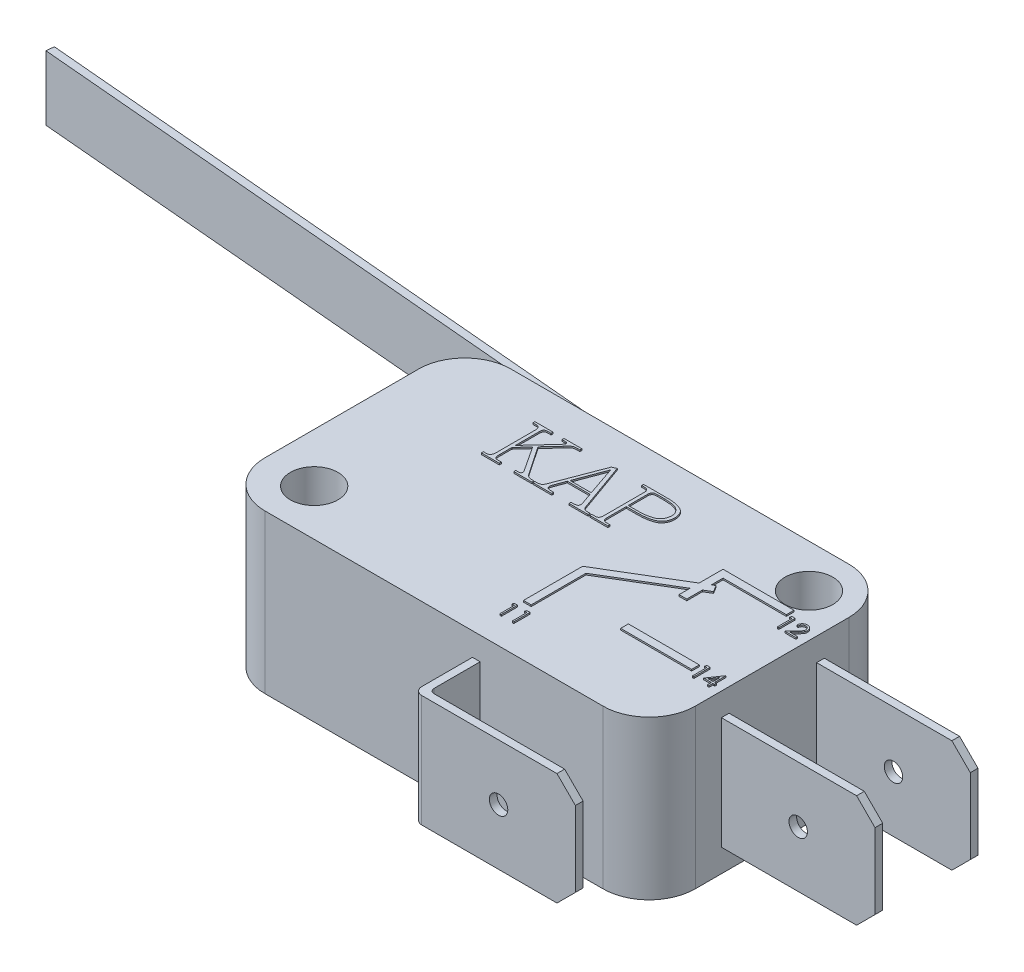
from build123d import *

# Parameters (mm, degrees)
ESBO_O1_W                 = 28
ESBO_O1_H                 = 16
RESSALTO_EXTRUS_O2_DEPTH  = 10.3
FILETE2_R                 = 3
FILETE3_R                 = 3
FILETE4_R                 = 3
FILETE5_R                 = 3
ESBO_O2_R                 = 1.55
CORTE_EXTRUS_O1_DEPTH     = 10.3
ESBO_O3_W                 = 0.5
ESBO_O3_H                 = 7.3
RESSALTO_EXTRUS_O3_DEPTH  = 10
ESBO_O4_W                 = 0.5
ESBO_O4_H                 = 7.3
RESSALTO_EXTRUS_O4_DEPTH  = 3.8
ESBO_O5_W                 = 0.5
ESBO_O5_H                 = 7.3
RESSALTO_EXTRUS_O5_DEPTH  = 10
FILETE8_R                 = 0.5
FILETE9_R                 = 0.3
ESBO_O6_W                 = 0.5
ESBO_O6_H                 = 4.2
RESSALTO_EXTRUS_O6_DEPTH  = 2
ESBO_O10_W                = 2.865331856
ESBO_O10_H                = 4.5
RESSALTO_EXTRUS_O7_DEPTH  = 1.9
FILETE11_R                = 0.6
CHANFRO1_SIZE             = 0.5
CHANFRO1_SIZE2            = 0.043744332
ESBO_O12_W                = 0.501909919
ESBO_O12_H                = 4.2
RESSALTO_EXTRUS_O8_DEPTH  = 50
CHANFRO2_SIZE             = 1.2
ESBO_O13_R                = 0.6
CORTE_EXTRUS_O2_DEPTH     = 10
CORTE_EXTRUS_O3_REACH     = 107.083
ESBO_O14_R                = 0.6
RESSALTO_EXTRUS_O9_DEPTH  = 0.1
CORTE_EXTRUS_O4_DEPTH     = 0.1
CORTE_EXTRUS_O5_DEPTH     = 0.1
ESBO_O18_W                = 4.619092447
ESBO_O18_H                = 0.5
RESSALTO_EXTRUS_O10_DEPTH = 0.1
RESSALTO_EXTRUS_O11_DEPTH = 0.1


with BuildPart() as part:
    # Esboço1 → Ressalto-extrusão2 (new body)
    with BuildSketch(Plane(origin=(0, 0, 0), x_dir=(1, 0, 0), z_dir=(0, 1, 0))):
        with Locations((-54.143455359, -5.955578496)):
            Rectangle(ESBO_O1_W, ESBO_O1_H)
    extrude(amount=RESSALTO_EXTRUS_O2_DEPTH)

    # Filete2
    filete2_edges = [part.edges().sort_by_distance(p)[0] for p in [
        (-40.143455359, 5.15, -2.044421504),
    ]]
    fillet(filete2_edges, radius=FILETE2_R)

    # Filete3
    filete3_edges = [part.edges().sort_by_distance(p)[0] for p in [
        (-40.143455359, 5.15, 13.955578496),
    ]]
    fillet(filete3_edges, radius=FILETE3_R)

    # Filete4
    filete4_edges = [part.edges().sort_by_distance(p)[0] for p in [
        (-68.143455359, 5.15, -2.044421504),
    ]]
    fillet(filete4_edges, radius=FILETE4_R)

    # Filete5
    filete5_edges = [part.edges().sort_by_distance(p)[0] for p in [
        (-68.143455359, 5.15, 13.955578496),
    ]]
    fillet(filete5_edges, radius=FILETE5_R)

    # Esboço2 → Corte-extrusão1 (cut)
    with BuildSketch(Plane(origin=(0, 10.3, 0), x_dir=(1, 0, 0), z_dir=(0, 1, 0))):
        with Locations((-64.943455359, -10.955578496)):
            Circle(ESBO_O2_R)
        with Locations((-42.943455359, -0.755578496)):
            Circle(ESBO_O2_R)
    extrude(amount=-CORTE_EXTRUS_O1_DEPTH, mode=Mode.SUBTRACT)

    # Esboço3 → Ressalto-extrusão3 (add)
    with BuildSketch(Plane(origin=(-40.143455359, 0, 0), x_dir=(0, 0, -1), z_dir=(1, 0, 0))):
        with Locations((-2.805578496, 5.15)):
            Rectangle(ESBO_O3_W, ESBO_O3_H)
        with Locations((-9.005578496, 5.15)):
            Rectangle(ESBO_O3_W, ESBO_O3_H)
    extrude(amount=RESSALTO_EXTRUS_O3_DEPTH)

    # Esboço4 → Ressalto-extrusão4 (add)
    with BuildSketch(Plane.XY.offset(13.955578496)):
        with Locations((-51.393455359, 5.15)):
            Rectangle(ESBO_O4_W, ESBO_O4_H)
    extrude(amount=RESSALTO_EXTRUS_O4_DEPTH)

    # Esboço5 → Ressalto-extrusão5 (add)
    with BuildSketch(Plane(origin=(-51.143455359, 0, 0), x_dir=(0, 0, -1), z_dir=(1, 0, 0))):
        with Locations((-17.505578496, 5.15)):
            Rectangle(ESBO_O5_W, ESBO_O5_H)
    extrude(amount=RESSALTO_EXTRUS_O5_DEPTH)

    # Filete8
    filete8_edges = [part.edges().sort_by_distance(p)[0] for p in [
        (-51.643455359, 5.15, 17.755578496),
    ]]
    fillet(filete8_edges, radius=FILETE8_R)

    # Filete9
    filete9_edges = [part.edges().sort_by_distance(p)[0] for p in [
        (-51.143455359, 5.15, 17.255578496),
    ]]
    fillet(filete9_edges, radius=FILETE9_R)

    # Esboço6 → Ressalto-extrusão6 (add)
    with BuildSketch(Plane(origin=(0, 0, -2.044421504), x_dir=(-1, 0, 0), z_dir=(0, 0, -1))):
        with Locations((51.193455359, 5.15)):
            Rectangle(ESBO_O6_W, ESBO_O6_H)
    extrude(amount=RESSALTO_EXTRUS_O6_DEPTH)

    # Esboço10 → Ressalto-extrusão7 (add)
    with BuildSketch(Plane(origin=(0, 0, -2.044421504), x_dir=(-1, 0, 0), z_dir=(0, 0, -1))):
        with Locations((61.480737934, 5.15)):
            Rectangle(ESBO_O10_W, ESBO_O10_H)
    extrude(amount=RESSALTO_EXTRUS_O7_DEPTH)

    # Filete11
    filete11_edges = [part.edges().sort_by_distance(p)[0] for p in [
        (-60.048072006, 5.15, -3.944421504),
        (-62.913403862, 5.15, -3.944421504),
    ]]
    fillet(filete11_edges, radius=FILETE11_R)

    # Chanfro1
    chanfro1_edges = [part.edges().sort_by_distance(p)[0] for p in [
        (-51.443455359, 5.15, -4.044421504),
    ]]
    chanfro1_side = [part.faces().sort_by_distance(p)[0] for p in [
        (-51.443455359, 5.15, -3.044421504),
    ]]
    chamfer(chanfro1_edges, length=CHANFRO1_SIZE, length2=CHANFRO1_SIZE2, reference=chanfro1_side[0])

    # Esboço12 → Ressalto-extrusão8 (add)
    with BuildSketch(Plane(origin=(-51.360425686, 0, -4.493455001), x_dir=(-0.08715574274765463, 0, 0.9961946980917459), z_dir=(-0.9961946980917459, 0, -0.08715574274765463))):
        with Locations((0.701703692, 5.15)):
            Rectangle(ESBO_O12_W, ESBO_O12_H)
    extrude(amount=RESSALTO_EXTRUS_O8_DEPTH)

    # Chanfro2
    chanfro2_edges = [part.edges().sort_by_distance(p)[0] for p in [
        (-41.143455359, 8.8, 17.505578496),
        (-41.143455359, 1.5, 17.505578496),
        (-30.143455359, 8.8, 9.005578496),
        (-30.143455359, 8.8, 2.805578496),
        (-30.143455359, 1.5, 9.005578496),
        (-30.143455359, 1.5, 2.805578496),
    ]]
    chamfer(chanfro2_edges, length=CHANFRO2_SIZE)

    # Esboço13 → Corte-extrusão2 (cut)
    with BuildSketch(Plane(origin=(0, 0, 2.555578496), x_dir=(-1, 0, 0), z_dir=(0, 0, -1))):
        with Locations((35.143455359, 5.15)):
            Circle(ESBO_O13_R)
    extrude(amount=-CORTE_EXTRUS_O2_DEPTH, mode=Mode.SUBTRACT)

    # Esboço14 → Corte-extrusão3 (cut, up to next)
    with BuildSketch(Plane.XY.offset(17.755578496), mode=Mode.PRIVATE) as corte_extrus_o3_sk1:
        with Locations((-46.143455359, 5.15)):
            Circle(ESBO_O14_R)
    corte_extrus_o3_tool1 = extrude(corte_extrus_o3_sk1.sketch, amount=-CORTE_EXTRUS_O3_REACH, mode=Mode.PRIVATE) & part.part
    add(corte_extrus_o3_tool1.solids().sort_by_distance((-46.143455, 5.15, 17.755578))[0], mode=Mode.SUBTRACT)

    # Esboço15 → Ressalto-extrusão9 (add)
    # profile 1 of 3: a face of its own
    with BuildSketch(Plane(origin=(0, 10.3, 0), x_dir=(1, 0, 0), z_dir=(0, 1, 0))):
        with BuildLine():
            Line((-59.396656894, -0.239444309), (-59.396656894, -0.367020288))
            Line((-59.396656894, -0.367020288), (-59.190580693, -0.367020288))
            add(Edge.make_bspline(
                [(-59.190580693, -0.367020288), (-59.177009382, -0.368006904), (-59.152221244, -0.36980897), (-59.118064577, -0.374641708), (-59.090610968, -0.384137369), (-59.065224964, -0.400060577), (-59.042360227, -0.422641553), (-59.039034878, -0.445224468), (-59.037584582, -0.455073626)],
                knots=[0, 0, 0, 0, 1.262221488, 2.305460404, 3.193798071, 3.925536549, 5.095257712, 6, 6, 6, 6], degree=3))
            add(Edge.make_bspline(
                [(-59.037584582, -0.455073626), (-59.037739135, -0.461820884), (-59.038077019, -0.476571827), (-59.045901653, -0.49981189), (-59.059214301, -0.525372767), (-59.075241223, -0.555627443), (-59.098813615, -0.587414781), (-59.125868258, -0.623362445), (-59.158658281, -0.662100531), (-59.18286178, -0.688585275), (-59.195667022, -0.702597446)],
                knots=[0, 0, 0, 0, 0.539792471, 1.180101162, 1.944160253, 2.858598411, 3.925007393, 5.117216575, 6.47481812, 8, 8, 8, 8], degree=3))
            Line((-59.195667022, -0.702597446), (-60.589981872, -2.217774212))
            Line((-60.589981872, -2.217774212), (-60.589981872, -0.692528384))
            add(Edge.make_bspline(
                [(-60.589981872, -0.692528384), (-60.590913615, -0.673922438), (-60.592751769, -0.637216454), (-60.587308007, -0.582491204), (-60.57711334, -0.528934409), (-60.563558648, -0.485635877), (-60.548830864, -0.452420249), (-60.53113344, -0.431448838), (-60.510503144, -0.412465043), (-60.484833597, -0.396958975), (-60.45466043, -0.385551352), (-60.42048543, -0.376603447), (-60.382171804, -0.3703913), (-60.355192425, -0.368632721), (-60.341071364, -0.367712278)],
                knots=[0, 0, 0, 0, 1.400530087, 2.762978816, 4.127758131, 5.497739154, 6.174673614, 6.843058875, 7.54523204, 8.279228029, 9.083656691, 9.96561945, 10.935201153, 12, 12, 12, 12], degree=3))
            Line((-60.341071364, -0.367712278), (-60.115527362, -0.367020288))
            Line((-60.115527362, -0.367020288), (-60.115527362, -0.239444309))
            Line((-60.115527362, -0.239444309), (-61.295137805, -0.239444309))
            Line((-61.295137805, -0.239444309), (-61.295137805, -0.367020288))
            Line((-61.295137805, -0.367020288), (-61.050721846, -0.367020288))
            add(Edge.make_bspline(
                [(-61.050721846, -0.367020288), (-61.038068508, -0.367210024), (-61.012262907, -0.367596979), (-60.972882767, -0.378037427), (-60.933428982, -0.397484873), (-60.900232558, -0.419267839), (-60.874673367, -0.442266735), (-60.857845466, -0.465258574), (-60.843553346, -0.492468567), (-60.830796806, -0.523954919), (-60.821632416, -0.560173515), (-60.813809227, -0.600412901), (-60.809220536, -0.645192029), (-60.807763344, -0.676473115), (-60.806998554, -0.692890629)],
                knots=[0, 0, 0, 0, 0.987254907, 2.013437533, 3.153849286, 4.41760048, 5.108485415, 5.831736821, 6.632637748, 7.508974052, 8.482681056, 9.550089628, 10.714193041, 12, 12, 12, 12], degree=3))
            Line((-60.806998554, -0.692890629), (-60.806305887, -3.189268371))
            add(Edge.make_bspline(
                [(-60.806305887, -3.189268371), (-60.806403615, -3.208569382), (-60.806591567, -3.245689363), (-60.80898769, -3.299084663), (-60.814931597, -3.347589131), (-60.821399142, -3.39172467), (-60.830892784, -3.431276787), (-60.843567021, -3.466220949), (-60.857859951, -3.496855134), (-60.879920684, -3.531482678), (-60.917510577, -3.566764022), (-60.976022728, -3.595365011), (-61.047961957, -3.610733136), (-61.099976893, -3.611471158), (-61.128016841, -3.611869007)],
                knots=[0, 0, 0, 0, 1.114485854, 2.143395108, 3.083588144, 3.934814357, 4.718055976, 5.427198437, 6.077800947, 6.666320568, 7.789556714, 9.001040062, 10.383335913, 12, 12, 12, 12], degree=3))
            Line((-61.128016841, -3.611869007), (-61.280760396, -3.61186833))
            Line((-61.280760396, -3.61186833), (-61.280760396, -3.739444309))
            Line((-61.280760396, -3.739444309), (-60.110734893, -3.739444309))
            Line((-60.110734893, -3.739444309), (-60.110734893, -3.61186833))
            Line((-60.110734893, -3.61186833), (-60.355150852, -3.61186833))
            add(Edge.make_bspline(
                [(-60.355150852, -3.61186833), (-60.378350407, -3.611478349), (-60.420856511, -3.610763829), (-60.478564029, -3.59231474), (-60.523761218, -3.560924196), (-60.55415209, -3.513809289), (-60.572512282, -3.453765063), (-60.583994344, -3.379548017), (-60.590857881, -3.289821618), (-60.590289112, -3.224765135), (-60.589981872, -3.189622491)],
                knots=[0, 0, 0, 0, 0.987402498, 1.809113741, 2.552224297, 3.292109504, 4.157561413, 5.219842034, 6.498195754, 8, 8, 8, 8], degree=3))
            Line((-60.589981872, -3.189622491), (-60.589981872, -2.45093281))
            Line((-60.589981872, -2.45093281), (-59.94299845, -1.736884604))
            Line((-59.94299845, -1.736884604), (-58.922202385, -3.286417787))
            add(Edge.make_bspline(
                [(-58.922202385, -3.286417787), (-58.909028817, -3.307355681), (-58.884674836, -3.346063574), (-58.855476904, -3.402504665), (-58.836567748, -3.453090332), (-58.833188677, -3.485563424), (-58.831661405, -3.500240617)],
                knots=[0, 0, 0, 0, 1.263833461, 2.336449306, 3.248108085, 4, 4, 4, 4], degree=3))
            add(Edge.make_bspline(
                [(-58.831661405, -3.500240617), (-58.832613335, -3.509802352), (-58.8344015, -3.527763702), (-58.843550558, -3.5521747), (-58.858020851, -3.572143412), (-58.884907399, -3.591092098), (-58.924490817, -3.606571619), (-58.958163954, -3.610090455), (-58.975183619, -3.611869007)],
                knots=[0, 0, 0, 0, 0.849990294, 1.596674143, 2.28592258, 3.003876983, 4.485647182, 6, 6, 6, 6], degree=3))
            Line((-58.975183619, -3.611869007), (-59.166618344, -3.61186833))
            Line((-59.166618344, -3.61186833), (-59.166618344, -3.739444309))
            Line((-59.166618344, -3.739444309), (-57.992463246, -3.739444309))
            Line((-57.992463246, -3.739444309), (-57.992463246, -3.61186833))
            Line((-57.992463246, -3.61186833), (-58.155407219, -3.61186833))
            add(Edge.make_bspline(
                [(-58.155407219, -3.61186833), (-58.181501271, -3.609927703), (-58.231457163, -3.606212461), (-58.301609187, -3.587616802), (-58.363984519, -3.561158574), (-58.415748294, -3.523465741), (-58.458740579, -3.482337378), (-58.497410455, -3.443912575), (-58.528937853, -3.406658077), (-58.545757562, -3.381142023), (-58.553630447, -3.369198595)],
                knots=[0, 0, 0, 0, 1.287472483, 2.464808304, 3.561586447, 4.608022933, 5.599870012, 6.49424919, 7.295195679, 8, 8, 8, 8], degree=3))
            Line((-58.553630447, -3.369198595), (-59.775262007, -1.557158185))
            Line((-59.775262007, -1.557158185), (-58.984504492, -0.702243325))
            add(Edge.make_bspline(
                [(-58.984504492, -0.702243325), (-58.96883649, -0.683738472), (-58.938790322, -0.648252139), (-58.89325983, -0.599408319), (-58.852021125, -0.554459321), (-58.812477235, -0.51581689), (-58.775824871, -0.482360176), (-58.741875278, -0.454486779), (-58.710743283, -0.431997739), (-58.672256618, -0.409426272), (-58.622019834, -0.388415293), (-58.556035236, -0.372818633), (-58.482843532, -0.365201792), (-58.431844462, -0.366851935), (-58.405254824, -0.367712278)],
                knots=[0, 0, 0, 0, 1.241729524, 2.381236261, 3.419728557, 4.36564157, 5.212105868, 5.960887229, 6.614543544, 7.17693217, 8.243253879, 9.388831814, 10.638602313, 12, 12, 12, 12], degree=3))
            Line((-58.405254824, -0.367712278), (-58.236879205, -0.367020288))
            Line((-58.236879205, -0.367020288), (-58.236879205, -0.239444309))
            Line((-58.236879205, -0.239444309), (-59.396656894, -0.239444309))
        make_face()
    # profile 2 of 3: a face of its own
    with BuildSketch(Plane(origin=(0, 10.3, 0), x_dir=(1, 0, 0), z_dir=(0, 1, 0))):
        with BuildLine():
            Line((-55.979441088, -0.195070291), (-56.248312321, -0.320747022))
            Line((-56.248312321, -0.320747022), (-57.347803611, -3.204978301))
            add(Edge.make_bspline(
                [(-57.347803611, -3.204978301), (-57.354768938, -3.228359069), (-57.368059941, -3.272973467), (-57.390691091, -3.335599482), (-57.415541962, -3.390470336), (-57.439067626, -3.439268782), (-57.464585244, -3.480667665), (-57.492119277, -3.514162083), (-57.519337741, -3.541865245), (-57.559658985, -3.569037173), (-57.620172341, -3.591748733), (-57.705136558, -3.60803397), (-57.806778344, -3.616272519), (-57.879926945, -3.613407843), (-57.919220658, -3.611869007)],
                knots=[0, 0, 0, 0, 1.104512961, 2.107594563, 3.011756317, 3.830702165, 4.559442837, 5.206612065, 5.79119889, 6.310728855, 7.395014269, 8.687913772, 10.220824974, 12, 12, 12, 12], degree=3))
            Line((-57.919220658, -3.611869007), (-57.919004665, -3.739444309))
            Line((-57.919004665, -3.739444309), (-56.696674344, -3.739444309))
            Line((-56.696674344, -3.739444309), (-56.696674344, -3.61186833))
            Line((-56.696674344, -3.61186833), (-56.903461493, -3.61186833))
            add(Edge.make_bspline(
                [(-56.903461493, -3.61186833), (-56.923613686, -3.611180117), (-56.962049349, -3.609867511), (-57.016003317, -3.600760668), (-57.063532152, -3.587378927), (-57.103724122, -3.567442448), (-57.13657311, -3.54040496), (-57.160096654, -3.505069233), (-57.174267542, -3.46173511), (-57.175820591, -3.430328935), (-57.176649199, -3.413572613)],
                knots=[0, 0, 0, 0, 1.259355824, 2.401930976, 3.412231504, 4.336295852, 5.187321622, 6.040919397, 6.954760224, 8, 8, 8, 8], degree=3))
            add(Edge.make_bspline(
                [(-57.176649199, -3.413572613), (-57.176103729, -3.39850952), (-57.174945435, -3.366523377), (-57.164989103, -3.31672408), (-57.150577313, -3.262148402), (-57.136778893, -3.225105368), (-57.129501804, -3.205569404)],
                knots=[0, 0, 0, 0, 0.842461083, 1.788947385, 2.833922551, 4, 4, 4, 4], degree=3))
            Line((-57.129501804, -3.205569404), (-56.884662661, -2.541346497))
            Line((-56.884662661, -2.541346497), (-55.40425466, -2.541346497))
            Line((-55.40425466, -2.541346497), (-55.155170139, -3.258261519))
            add(Edge.make_bspline(
                [(-55.155170139, -3.258261519), (-55.146309776, -3.285769223), (-55.12999504, -3.336419619), (-55.125169166, -3.389376202), (-55.122964174, -3.413572613)],
                knots=[0, 0, 0, 0, 1.086179257, 2, 2, 2, 2], degree=3))
            add(Edge.make_bspline(
                [(-55.122964174, -3.413572613), (-55.123020195, -3.429408683), (-55.123125376, -3.459141236), (-55.136525788, -3.500198314), (-55.157509821, -3.535264199), (-55.19023284, -3.562321788), (-55.233231053, -3.583694792), (-55.288714554, -3.597647446), (-55.356501387, -3.607997846), (-55.406031086, -3.610507907), (-55.432888956, -3.611869007)],
                knots=[0, 0, 0, 0, 0.900344709, 1.690416098, 2.438578846, 3.207015684, 4.081871439, 5.165788297, 6.463126323, 8, 8, 8, 8], degree=3))
            Line((-55.432888956, -3.611869007), (-55.573444146, -3.61186833))
            Line((-55.573444146, -3.61186833), (-55.573444146, -3.739444309))
            Line((-55.573444146, -3.739444309), (-54.337406062, -3.739444309))
            Line((-54.337406062, -3.739444309), (-54.337406062, -3.61186833))
            Line((-54.337406062, -3.61186833), (-54.529998617, -3.61186833))
            add(Edge.make_bspline(
                [(-54.529998617, -3.61186833), (-54.546054917, -3.611475793), (-54.577733931, -3.610701319), (-54.624159502, -3.600246062), (-54.669068061, -3.584328387), (-54.711720874, -3.561623879), (-54.751159573, -3.532305637), (-54.78525782, -3.496019202), (-54.813687322, -3.45283433), (-54.826977358, -3.420540713), (-54.833839712, -3.403865797)],
                knots=[0, 0, 0, 0, 0.977796179, 1.929187921, 2.888178011, 3.878585256, 4.865674208, 5.873199887, 6.901819688, 8, 8, 8, 8], degree=3))
            Line((-54.833839712, -3.403865797), (-55.979441088, -0.195070291))
        make_face()
        Polygon((-55.455951448, -2.413770518), (-56.832965874, -2.413770518), (-56.109210851, -0.485095287), align=None, mode=Mode.SUBTRACT)
    # profile 3 of 3: a face of its own
    with BuildSketch(Plane(origin=(0, 10.3, 0), x_dir=(1, 0, 0), z_dir=(0, 1, 0))):
        with BuildLine():
            add(Edge.make_bspline(
                [(-53.75083701, -3.336513247), (-53.75177433, -3.357662496), (-53.75354248, -3.397558188), (-53.766423766, -3.453172683), (-53.785312567, -3.501830267), (-53.813662398, -3.541371885), (-53.846889807, -3.573673416), (-53.88647064, -3.594979544), (-53.929546713, -3.610181792), (-53.960315921, -3.611295201), (-53.976173144, -3.611869007)],
                knots=[0, 0, 0, 0, 1.267387468, 2.390784652, 3.410395171, 4.37587245, 5.288113809, 6.163469608, 7.053525486, 8, 8, 8, 8], degree=3))
            Line((-53.976173144, -3.611869007), (-54.225291519, -3.61186833))
            Line((-54.225291519, -3.61186833), (-54.225291519, -3.739444309))
            Line((-54.225291519, -3.739444309), (-53.043670108, -3.739444309))
            Line((-53.043670108, -3.739444309), (-53.043670108, -3.61186833))
            Line((-53.043670108, -3.61186833), (-53.25960344, -3.61186833))
            add(Edge.make_bspline(
                [(-53.25960344, -3.61186833), (-53.272234652, -3.612376426), (-53.298776145, -3.61344407), (-53.339887228, -3.604517773), (-53.383953335, -3.590603254), (-53.430162093, -3.570055584), (-53.475416682, -3.537029484), (-53.506947497, -3.483466733), (-53.528751914, -3.415628057), (-53.532475218, -3.364560746), (-53.534512995, -3.336611426)],
                knots=[0, 0, 0, 0, 0.682259272, 1.433605937, 2.261089795, 3.185291488, 4.166893495, 5.236514538, 6.487534643, 8, 8, 8, 8], degree=3))
            Line((-53.534512995, -3.336611426), (-53.534512995, -2.053232298))
            Line((-53.534512995, -2.053232298), (-52.896442836, -2.053232298))
            add(Edge.make_bspline(
                [(-52.896442836, -2.053232298), (-52.826692071, -2.052971574), (-52.691881182, -2.052467659), (-52.497408779, -2.040989234), (-52.317620125, -2.023284236), (-52.15363131, -1.995179218), (-52.00393382, -1.961542481), (-51.870065693, -1.917583335), (-51.7501049, -1.867485649), (-51.67915827, -1.824787952), (-51.645150506, -1.804321114)],
                knots=[0, 0, 0, 0, 1.295320801, 2.503533078, 3.61710685, 4.64887347, 5.592259911, 6.463780208, 7.263623935, 8, 8, 8, 8], degree=3))
            add(Edge.make_bspline(
                [(-51.645150506, -1.804321114), (-51.618702106, -1.781802191), (-51.566682743, -1.73751142), (-51.499451909, -1.66187187), (-51.441854203, -1.581682589), (-51.395046139, -1.496058888), (-51.359707376, -1.404775988), (-51.333746154, -1.30887834), (-51.319218237, -1.207336337), (-51.317422976, -1.138062286), (-51.316505434, -1.102656952)],
                knots=[0, 0, 0, 0, 1.036557021, 2.038725857, 3.013801426, 3.98075378, 4.944818413, 5.931168592, 6.942639212, 8, 8, 8, 8], degree=3))
            add(Edge.make_bspline(
                [(-51.316505434, -1.102656952), (-51.3196446, -1.05862045), (-51.325690274, -0.973811178), (-51.350912899, -0.852922232), (-51.387986812, -0.743773808), (-51.438076749, -0.646490342), (-51.502197451, -0.56189269), (-51.579296287, -0.489997758), (-51.668937372, -0.429983456), (-51.770484817, -0.384289955), (-51.879274825, -0.347276907), (-51.992282963, -0.314162527), (-52.109661978, -0.288520904), (-52.230269502, -0.266493585), (-52.354857326, -0.25156801), (-52.483015693, -0.241945202), (-52.615118526, -0.237578969), (-52.704348844, -0.239275642), (-52.74964755, -0.240136976)],
                knots=[0, 0, 0, 0, 1.113885896, 2.145216986, 3.108704468, 4.017164173, 4.896142133, 5.775662481, 6.667585812, 7.60759451, 8.578513185, 9.568608921, 10.57959157, 11.611120815, 12.663701845, 13.746527728, 14.856001206, 16, 16, 16, 16], degree=3))
            Line((-52.74964755, -0.240136976), (-54.220499049, -0.239444309))
            Line((-54.220499049, -0.239444309), (-54.220499049, -0.367020288))
            Line((-54.220499049, -0.367020288), (-54.000045439, -0.367020288))
            add(Edge.make_bspline(
                [(-54.000045439, -0.367020288), (-53.978998042, -0.368454815), (-53.939513243, -0.37114598), (-53.885237556, -0.388235368), (-53.839495964, -0.414422662), (-53.806057667, -0.45329752), (-53.780180216, -0.497805315), (-53.763256705, -0.548851576), (-53.752418156, -0.604831261), (-53.751833536, -0.644069306), (-53.751529677, -0.664463524)],
                knots=[0, 0, 0, 0, 1.145528006, 2.149004049, 3.075344815, 3.975649811, 4.90642939, 5.866056375, 6.890869561, 8, 8, 8, 8], degree=3))
            Line((-53.751529677, -0.664463524), (-53.75083701, -3.336513247))
        make_face()
        with BuildLine():
            Line((-53.534512995, -1.925656319), (-53.534512995, -0.664064038))
            add(Edge.make_bspline(
                [(-53.534512995, -0.664064038), (-53.53428748, -0.638458109), (-53.533869884, -0.591042573), (-53.51986791, -0.52578273), (-53.496944653, -0.471506743), (-53.459930323, -0.429084067), (-53.408924453, -0.399709626), (-53.344775591, -0.379245443), (-53.265639947, -0.368206737), (-53.207980719, -0.367886011), (-53.176747474, -0.367712278)],
                knots=[0, 0, 0, 0, 1.122442858, 2.078472939, 2.914660217, 3.684593047, 4.504844374, 5.468180703, 6.628546758, 8, 8, 8, 8], degree=3))
            Line((-53.176747474, -0.367712278), (-52.749215564, -0.367020288))
            add(Edge.make_bspline(
                [(-52.749215564, -0.367020288), (-52.696890528, -0.36812498), (-52.596194399, -0.370250888), (-52.450736817, -0.377845376), (-52.317308263, -0.392707921), (-52.195506483, -0.411161835), (-52.086072305, -0.437227657), (-51.988212251, -0.4671024), (-51.901697645, -0.502495086), (-51.850993418, -0.532821953), (-51.826806642, -0.547288382)],
                knots=[0, 0, 0, 0, 1.320911742, 2.542008738, 3.674415017, 4.708166761, 5.649029251, 6.510591609, 7.289526944, 8, 8, 8, 8], degree=3))
            add(Edge.make_bspline(
                [(-51.826806642, -0.547288382), (-51.803577558, -0.565826859), (-51.758115601, -0.602108765), (-51.697411262, -0.662186459), (-51.647265244, -0.726989493), (-51.604678256, -0.794308321), (-51.573213207, -0.866568343), (-51.548822319, -0.941608623), (-51.535911182, -1.021094775), (-51.533869688, -1.075113773), (-51.532828772, -1.102656952)],
                knots=[0, 0, 0, 0, 1.091379982, 2.135954675, 3.127790422, 4.096128938, 5.053839209, 6.015117782, 6.987949256, 8, 8, 8, 8], degree=3))
            add(Edge.make_bspline(
                [(-51.532828772, -1.102656952), (-51.53743751, -1.147907388), (-51.546282179, -1.234747891), (-51.577792514, -1.357558224), (-51.623016591, -1.466761185), (-51.680840344, -1.563564673), (-51.753158965, -1.6467432), (-51.840035698, -1.715255363), (-51.939795842, -1.770717428), (-52.05113808, -1.810251523), (-52.166261311, -1.841208926), (-52.280049694, -1.868469812), (-52.390580634, -1.890736982), (-52.497841653, -1.908332653), (-52.602225722, -1.920059931), (-52.703312585, -1.927012209), (-52.801207239, -1.929485077), (-52.865209631, -1.92691721), (-52.896636485, -1.925656319)],
                knots=[0, 0, 0, 0, 1.213437667, 2.328718697, 3.37182706, 4.360503359, 5.327261977, 6.297953242, 7.300918313, 8.361412409, 9.444108255, 10.484583703, 11.485647777, 12.45470893, 13.386471708, 14.289729884, 15.160212524, 16, 16, 16, 16], degree=3))
            Line((-52.896636485, -1.925656319), (-53.534512995, -1.925656319))
        make_face(mode=Mode.SUBTRACT)
    extrude(amount=RESSALTO_EXTRUS_O9_DEPTH)

    # Esboço16 → Corte-extrusão4 (cut)
    with BuildSketch(Plane.XZ):
        Polygon((-62.06254554, 8.911389416), (-61.600506278, 12.411389416), (-61.555634483, 12.411389416), (-60.110622463, 9.539594544), (-58.669116053, 12.411389416), (-58.623543137, 12.411389416), (-58.158699387, 8.911389416), (-58.474204194, 8.911389416), (-58.809340412, 11.429818903), (-60.072761887, 8.911389416), (-60.143575188, 8.911389416), (-61.411904515, 11.435427878), (-61.746339611, 8.911389416), align=None)
        Polygon((-57.709981438, 12.411389416), (-57.373442976, 12.411389416), (-56.20677631, 9.653176275), (-55.040109643, 12.411389416), (-54.703571181, 12.411389416), (-56.184340412, 8.911389416), (-56.229212207, 8.911389416), align=None)
        Polygon((-54.165109643, 12.411389416), (-52.011263489, 12.411389416), (-53.851007079, 8.821645827), (-54.122341213, 8.970984769), (-52.54271381, 12.052415057), (-54.165109643, 12.052415057), align=None)
    extrude(amount=-CORTE_EXTRUS_O4_DEPTH, mode=Mode.SUBTRACT)

    # Esboço17 → Corte-extrusão5 (cut)
    # profile 1 of 22: a face of its own
    with BuildSketch(Plane.XZ):
        Polygon((-62.657152044, 7.913739448), (-62.412550264, 7.913739448), (-62.412550264, 6.590822782), (-62.531273555, 6.590822782), (-62.531273555, 7.778055688), (-62.734799196, 7.778055688), align=None)
    # profile 2 of 22: a face of its own
    with BuildSketch(Plane.XZ):
        with BuildLine():
            Line((-61.089633597, 7.913739448), (-61.089633597, 7.778055688))
            Line((-61.089633597, 7.778055688), (-61.539616069, 7.778055688))
            Line((-61.539616069, 7.778055688), (-61.610903045, 7.430101044))
            add(Edge.make_bspline(
                [(-61.610903045, 7.430101044), (-61.596896807, 7.433967843), (-61.569761936, 7.441459155), (-61.529711631, 7.449776812), (-61.491690173, 7.454790834), (-61.467017637, 7.455475466), (-61.455078726, 7.455806756)],
                knots=[0, 0, 0, 0, 1.100273476, 2.13160584, 3.095893838, 4, 4, 4, 4], degree=3))
            add(Edge.make_bspline(
                [(-61.455078726, 7.455806756), (-61.440306003, 7.455487013), (-61.411259139, 7.454858317), (-61.368759894, 7.448821338), (-61.328190616, 7.439319049), (-61.289636148, 7.426044328), (-61.253025167, 7.409069518), (-61.218694511, 7.387865076), (-61.186128871, 7.363095037), (-61.155912474, 7.334616417), (-61.128500012, 7.30327402), (-61.104397986, 7.269574468), (-61.083925817, 7.233845262), (-61.067460889, 7.195745032), (-61.054313239, 7.155694995), (-61.045562336, 7.113273751), (-61.039735187, 7.068881158), (-61.039084166, 7.038527942), (-61.038752187, 7.023049762)],
                knots=[0, 0, 0, 0, 1.052922333, 2.070308379, 3.05430497, 4.020497103, 4.973039431, 5.925935799, 6.892292201, 7.88610001, 8.88166317, 9.857072816, 10.836096531, 11.812156883, 12.81219415, 13.836441305, 14.89672472, 16, 16, 16, 16], degree=3))
            add(Edge.make_bspline(
                [(-61.038752187, 7.023049762), (-61.03900357, 7.012269041), (-61.039502938, 6.990853293), (-61.042042404, 6.959048789), (-61.046931797, 6.927917599), (-61.053496383, 6.897455594), (-61.06201688, 6.867720444), (-61.072331493, 6.838627039), (-61.084954396, 6.810356459), (-61.098800184, 6.782641205), (-61.11439037, 6.756107841), (-61.131693556, 6.731294087), (-61.14997456, 6.707827707), (-61.169644965, 6.685960373), (-61.190887603, 6.66583578), (-61.213445209, 6.647334495), (-61.237137785, 6.630143635), (-61.262331879, 6.614961014), (-61.288466092, 6.600989896), (-61.315917828, 6.589528321), (-61.3440622, 6.579281187), (-61.373304281, 6.5711133), (-61.403577835, 6.564713198), (-61.434932765, 6.560366245), (-61.467204626, 6.557200151), (-61.489080003, 6.557001956), (-61.500129975, 6.556901842)],
                knots=[0, 0, 0, 0, 1.056347294, 2.098418968, 3.122841568, 4.141288669, 5.149314143, 6.15115421, 7.162517403, 8.180376062, 9.185164535, 10.17417709, 11.141909838, 12.097768115, 13.052685741, 14.0056014, 14.954263652, 15.917497458, 16.885230207, 17.854509472, 18.828990115, 19.81800267, 20.826176721, 21.857883937, 22.917946725, 24, 24, 24, 24], degree=3))
            add(Edge.make_bspline(
                [(-61.500129975, 6.556901842), (-61.513311585, 6.557162962), (-61.539244845, 6.557676685), (-61.577239226, 6.563050934), (-61.613795044, 6.57074801), (-61.648618029, 6.58232779), (-61.682020263, 6.596837274), (-61.713552064, 6.615175231), (-61.744019128, 6.635956024), (-61.772182904, 6.660479252), (-61.798322268, 6.687283692), (-61.821721454, 6.716371848), (-61.842560634, 6.747263631), (-61.860506092, 6.780109064), (-61.87581338, 6.814821842), (-61.887838688, 6.851532024), (-61.897544494, 6.890047799), (-61.901650609, 6.916564156), (-61.903736161, 6.930032183)],
                knots=[0, 0, 0, 0, 1.0467383, 2.05933395, 3.04377827, 4.011590433, 4.970194871, 5.932262533, 6.905835911, 7.896367577, 8.894135286, 9.877477877, 10.858688626, 11.851381753, 12.8477658, 13.868841284, 14.917554742, 16, 16, 16, 16], degree=3))
            Line((-61.903736161, 6.930032183), (-61.785012871, 6.930032183))
            add(Edge.make_bspline(
                [(-61.785012871, 6.930032183), (-61.78209166, 6.917416679), (-61.776476931, 6.893168979), (-61.764152734, 6.859101478), (-61.749084383, 6.828742724), (-61.731166668, 6.801691126), (-61.709792102, 6.778102011), (-61.685401515, 6.757080085), (-61.658055798, 6.738115081), (-61.627669071, 6.722307071), (-61.595611747, 6.708825131), (-61.562059855, 6.699847556), (-61.527926962, 6.693535016), (-61.504840792, 6.692903131), (-61.493239784, 6.692585602)],
                knots=[0, 0, 0, 0, 1.136247022, 2.183929868, 3.172523383, 4.106158343, 5.02341133, 5.958108904, 6.928429099, 7.938127109, 8.96079061, 9.975095812, 10.982467395, 12, 12, 12, 12], degree=3))
            add(Edge.make_bspline(
                [(-61.493239784, 6.692585602), (-61.481916205, 6.692895837), (-61.459619986, 6.693506691), (-61.426807349, 6.698208341), (-61.395128078, 6.705449447), (-61.364894762, 6.71628597), (-61.335578346, 6.729456444), (-61.307920403, 6.746357678), (-61.281120804, 6.76580834), (-61.256012551, 6.788092542), (-61.233016688, 6.81264954), (-61.212698154, 6.83891034), (-61.195773547, 6.866924743), (-61.181510952, 6.896207751), (-61.170680687, 6.927080301), (-61.162954483, 6.959397709), (-61.158417613, 6.9932398), (-61.157793506, 7.016322545), (-61.157475478, 7.028084901)],
                knots=[0, 0, 0, 0, 1.027316725, 2.022795036, 3.002884548, 3.971462791, 4.93288096, 5.914575861, 6.907176829, 7.935150275, 8.956128384, 9.956726525, 10.942570165, 11.921478529, 12.907843606, 13.90538589, 14.932640048, 16, 16, 16, 16], degree=3))
            add(Edge.make_bspline(
                [(-61.157475478, 7.028084901), (-61.157724367, 7.038696867), (-61.158211533, 7.05946828), (-61.162191838, 7.089857265), (-61.169115217, 7.118611064), (-61.178724839, 7.145868528), (-61.190925724, 7.171655364), (-61.205835491, 7.195998188), (-61.223733948, 7.218576154), (-61.244179394, 7.239399828), (-61.266577522, 7.25861798), (-61.291313699, 7.275001013), (-61.317870278, 7.288783506), (-61.3459273, 7.30067766), (-61.376152127, 7.309220203), (-61.407946212, 7.31563366), (-61.441652884, 7.319343633), (-61.464698352, 7.319858395), (-61.476544321, 7.320122995)],
                knots=[0, 0, 0, 0, 1.045622112, 2.046656509, 3.013763289, 3.955457236, 4.890082067, 5.820317437, 6.762574623, 7.722996705, 8.69280354, 9.665887285, 10.63943826, 11.638615906, 12.663482002, 13.728887084, 14.832589034, 16, 16, 16, 16], degree=3))
            add(Edge.make_bspline(
                [(-61.476544321, 7.320122995), (-61.48679841, 7.319903546), (-61.507970503, 7.319450438), (-61.540447286, 7.316114232), (-61.574575407, 7.310732118), (-61.610224041, 7.303328983), (-61.647500245, 7.293641046), (-61.686325355, 7.282031696), (-61.726781003, 7.268151655), (-61.754039786, 7.257669539), (-61.768052401, 7.252281115)],
                knots=[0, 0, 0, 0, 0.817624296, 1.688186739, 2.600797293, 3.572016777, 4.590301741, 5.671205678, 6.80286297, 8, 8, 8, 8], degree=3))
            Line((-61.768052401, 7.252281115), (-61.63236864, 7.913739448))
            Line((-61.63236864, 7.913739448), (-61.089633597, 7.913739448))
        make_face()
    # profile 3 of 22: a face of its own
    with BuildSketch(Plane.XZ):
        Polygon((-60.241610093, 7.913739448), (-59.63103317, 6.590822782), (-59.760091747, 6.590822782), (-59.955667168, 7.014834534), (-60.55537879, 7.014834534), (-60.756519365, 6.590822782), (-60.886107956, 6.590822782), (-60.258570563, 7.913739448), align=None)
        Polygon((-60.251415365, 7.655887302), (-60.490982005, 7.150518295), (-60.018208901, 7.150518295), align=None, mode=Mode.SUBTRACT)
    # profile 4 of 22: a face of its own
    with BuildSketch(Plane.XZ):
        with BuildLine():
            Line((-58.833891076, 7.506688166), (-58.952614367, 7.506688166))
            add(Edge.make_bspline(
                [(-58.952614367, 7.506688166), (-58.951840591, 7.52243877), (-58.950320918, 7.553372536), (-58.943204273, 7.598474131), (-58.933021263, 7.64158413), (-58.9186236, 7.682356389), (-58.900742953, 7.721151414), (-58.879300354, 7.757815111), (-58.853902678, 7.792207613), (-58.825098347, 7.824010093), (-58.793813772, 7.853185157), (-58.760058253, 7.878379252), (-58.724587067, 7.89966599), (-58.68750783, 7.917461579), (-58.648402201, 7.930819199), (-58.607625049, 7.940730355), (-58.564997221, 7.946693438), (-58.535953522, 7.947334404), (-58.521182409, 7.947660389)],
                knots=[0, 0, 0, 0, 1.10065271, 2.161652631, 3.183658789, 4.190468796, 5.17591951, 6.163126047, 7.15150782, 8.156236427, 9.156009102, 10.134482811, 11.092018607, 12.041330605, 13.001268258, 13.972401359, 14.968799086, 16, 16, 16, 16], degree=3))
            add(Edge.make_bspline(
                [(-58.521182409, 7.947660389), (-58.506676411, 7.947320793), (-58.478172642, 7.946653501), (-58.436571821, 7.940922993), (-58.396968499, 7.931947725), (-58.359440087, 7.919355291), (-58.324286009, 7.902427843), (-58.29124218, 7.882093655), (-58.259915206, 7.85857604), (-58.231715619, 7.830887843), (-58.205821196, 7.801329203), (-58.183481951, 7.769772763), (-58.16435138, 7.737180146), (-58.148405441, 7.70330282), (-58.13666696, 7.667821807), (-58.127754959, 7.631253667), (-58.122717514, 7.593219885), (-58.121944392, 7.567477228), (-58.121551332, 7.554389489)],
                knots=[0, 0, 0, 0, 1.111607364, 2.184268762, 3.212621178, 4.221274766, 5.211760367, 6.196651075, 7.1921475, 8.207485113, 9.220403448, 10.201281604, 11.166441695, 12.114753415, 13.065576456, 14.026450734, 14.996634279, 16, 16, 16, 16], degree=3))
            add(Edge.make_bspline(
                [(-58.121551332, 7.554389489), (-58.122191345, 7.535963968), (-58.12346014, 7.499436268), (-58.134313491, 7.445758031), (-58.151264404, 7.393750995), (-58.17167412, 7.351894931), (-58.192263406, 7.318166795), (-58.210817316, 7.290397374), (-58.232537646, 7.26049739), (-58.257740531, 7.228566968), (-58.285904622, 7.194356001), (-58.317285023, 7.157885156), (-58.352105506, 7.119531243), (-58.37654488, 7.093335376), (-58.389208751, 7.079761333)],
                knots=[0, 0, 0, 0, 1.184426356, 2.348067706, 3.509069118, 4.696110526, 5.333549288, 6.050745305, 6.844228056, 7.710549037, 8.667450064, 9.695053472, 10.805634456, 12, 12, 12, 12], degree=3))
            Line((-58.389208751, 7.079761333), (-58.720202925, 6.726506542))
            Line((-58.720202925, 6.726506542), (-58.104590862, 6.726506542))
            Line((-58.104590862, 6.726506542), (-58.104590862, 6.590822782))
            Line((-58.104590862, 6.590822782), (-59.003495777, 6.590822782))
            Line((-59.003495777, 6.590822782), (-58.490441557, 7.138327957))
            add(Edge.make_bspline(
                [(-58.490441557, 7.138327957), (-58.477950242, 7.151367495), (-58.453956984, 7.17641378), (-58.420021308, 7.212980316), (-58.38954169, 7.246903505), (-58.36232083, 7.278119254), (-58.338949237, 7.307084162), (-58.31820884, 7.332860136), (-58.301590894, 7.356579824), (-58.28355561, 7.384074045), (-58.266087825, 7.417642986), (-58.2510775, 7.458666136), (-58.241924864, 7.500896378), (-58.240826906, 7.52943435), (-58.240274623, 7.543789195)],
                knots=[0, 0, 0, 0, 1.329631726, 2.553950428, 3.673215718, 4.687767853, 5.603093632, 6.413772471, 7.123043292, 7.734684054, 8.834405432, 9.900288307, 10.943827018, 12, 12, 12, 12], degree=3))
            add(Edge.make_bspline(
                [(-58.240274623, 7.543789195), (-58.240514918, 7.552815795), (-58.240988495, 7.57060549), (-58.245168041, 7.596688024), (-58.251484214, 7.621847939), (-58.260534952, 7.646162625), (-58.272481547, 7.669387618), (-58.287023569, 7.69155119), (-58.303801956, 7.712978269), (-58.323211513, 7.73306895), (-58.344533724, 7.751469287), (-58.367058932, 7.767769164), (-58.39089037, 7.78139109), (-58.415927559, 7.792557829), (-58.442100698, 7.801317571), (-58.469460408, 7.807387332), (-58.497931093, 7.81119827), (-58.517371729, 7.811713895), (-58.527277578, 7.811976628)],
                knots=[0, 0, 0, 0, 0.991446411, 1.95395049, 2.89581595, 3.838931463, 4.798493298, 5.75982156, 6.748411868, 7.785213223, 8.824556874, 9.840280684, 10.836137867, 11.835679398, 12.848801643, 13.863922112, 14.911575587, 16, 16, 16, 16], degree=3))
            add(Edge.make_bspline(
                [(-58.527277578, 7.811976628), (-58.537623101, 7.811706363), (-58.55794, 7.811175607), (-58.587769515, 7.807462873), (-58.616225747, 7.801057749), (-58.643380276, 7.792297518), (-58.669279048, 7.781162888), (-58.693796112, 7.767294282), (-58.71687643, 7.750745164), (-58.73856339, 7.731982216), (-58.758544715, 7.711092379), (-58.776100528, 7.687805279), (-58.79144032, 7.662546108), (-58.804824167, 7.635383019), (-58.815693133, 7.606069536), (-58.823998461, 7.574709719), (-58.830570275, 7.541439733), (-58.832765757, 7.518464418), (-58.833891076, 7.506688166)],
                knots=[0, 0, 0, 0, 1.031018746, 2.02475058, 2.990194455, 3.934040569, 4.864654155, 5.795059489, 6.735614925, 7.690564532, 8.649604399, 9.611025574, 10.590972636, 11.591080095, 12.624614302, 13.701020113, 14.821632451, 16, 16, 16, 16], degree=3))
        make_face()
    # profile 5 of 22: a face of its own
    with BuildSketch(Plane.XZ):
        with BuildLine():
            Line((-57.154804538, 7.913739448), (-57.154804538, 7.778055688))
            Line((-57.154804538, 7.778055688), (-57.604787009, 7.778055688))
            Line((-57.604787009, 7.778055688), (-57.676073985, 7.430101044))
            add(Edge.make_bspline(
                [(-57.676073985, 7.430101044), (-57.662067747, 7.433967843), (-57.634932876, 7.441459155), (-57.594882571, 7.449776812), (-57.556861113, 7.454790834), (-57.532188577, 7.455475466), (-57.520249666, 7.455806756)],
                knots=[0, 0, 0, 0, 1.100273476, 2.13160584, 3.095893838, 4, 4, 4, 4], degree=3))
            add(Edge.make_bspline(
                [(-57.520249666, 7.455806756), (-57.505476943, 7.455487013), (-57.476430079, 7.454858317), (-57.433930834, 7.448821338), (-57.393361556, 7.439319049), (-57.354807089, 7.426044328), (-57.318196107, 7.409069518), (-57.283865451, 7.387865076), (-57.251299811, 7.363095037), (-57.221083414, 7.334616417), (-57.193670952, 7.30327402), (-57.169568927, 7.269574468), (-57.149096757, 7.233845262), (-57.132631829, 7.195745032), (-57.119484179, 7.155694995), (-57.110733276, 7.113273751), (-57.104906127, 7.068881158), (-57.104255106, 7.038527942), (-57.103923127, 7.023049762)],
                knots=[0, 0, 0, 0, 1.052922333, 2.070308379, 3.05430497, 4.020497103, 4.973039431, 5.925935799, 6.892292201, 7.88610001, 8.88166317, 9.857072816, 10.836096531, 11.812156883, 12.81219415, 13.836441305, 14.89672472, 16, 16, 16, 16], degree=3))
            add(Edge.make_bspline(
                [(-57.103923127, 7.023049762), (-57.10417451, 7.012269041), (-57.104673878, 6.990853293), (-57.107213344, 6.959048789), (-57.112102737, 6.927917599), (-57.118667323, 6.897455594), (-57.12718782, 6.867720444), (-57.137502433, 6.838627039), (-57.150125336, 6.810356459), (-57.163971124, 6.782641205), (-57.17956131, 6.756107841), (-57.196864496, 6.731294087), (-57.2151455, 6.707827707), (-57.234815905, 6.685960373), (-57.256058543, 6.66583578), (-57.278616149, 6.647334495), (-57.302308725, 6.630143635), (-57.327502819, 6.614961014), (-57.353637032, 6.600989896), (-57.381088769, 6.589528321), (-57.40923314, 6.579281187), (-57.438475221, 6.5711133), (-57.468748776, 6.564713198), (-57.500103706, 6.560366245), (-57.532375566, 6.557200151), (-57.554250943, 6.557001956), (-57.565300915, 6.556901842)],
                knots=[0, 0, 0, 0, 1.056347294, 2.098418968, 3.122841568, 4.141288669, 5.149314143, 6.15115421, 7.162517403, 8.180376062, 9.185164535, 10.17417709, 11.141909838, 12.097768115, 13.052685741, 14.0056014, 14.954263652, 15.917497458, 16.885230207, 17.854509472, 18.828990115, 19.81800267, 20.826176721, 21.857883937, 22.917946725, 24, 24, 24, 24], degree=3))
            add(Edge.make_bspline(
                [(-57.565300915, 6.556901842), (-57.578482525, 6.557162962), (-57.604415785, 6.557676685), (-57.642410166, 6.563050934), (-57.678965985, 6.57074801), (-57.713788969, 6.58232779), (-57.747191203, 6.596837274), (-57.778723004, 6.615175231), (-57.809190068, 6.635956024), (-57.837353844, 6.660479252), (-57.863493208, 6.687283692), (-57.886892395, 6.716371848), (-57.907731574, 6.747263631), (-57.925677032, 6.780109064), (-57.94098432, 6.814821842), (-57.953009628, 6.851532024), (-57.962715435, 6.890047799), (-57.966821549, 6.916564156), (-57.968907102, 6.930032183)],
                knots=[0, 0, 0, 0, 1.0467383, 2.05933395, 3.04377827, 4.011590433, 4.970194871, 5.932262533, 6.905835911, 7.896367577, 8.894135286, 9.877477877, 10.858688626, 11.851381753, 12.8477658, 13.868841284, 14.917554742, 16, 16, 16, 16], degree=3))
            Line((-57.968907102, 6.930032183), (-57.850183811, 6.930032183))
            add(Edge.make_bspline(
                [(-57.850183811, 6.930032183), (-57.8472626, 6.917416679), (-57.841647871, 6.893168979), (-57.829323674, 6.859101478), (-57.814255323, 6.828742724), (-57.796337608, 6.801691126), (-57.774963043, 6.778102011), (-57.750572455, 6.757080085), (-57.723226738, 6.738115081), (-57.692840011, 6.722307071), (-57.660782687, 6.708825131), (-57.627230795, 6.699847556), (-57.593097902, 6.693535016), (-57.570011732, 6.692903131), (-57.558410724, 6.692585602)],
                knots=[0, 0, 0, 0, 1.136247022, 2.183929868, 3.172523383, 4.106158343, 5.02341133, 5.958108904, 6.928429099, 7.938127109, 8.96079061, 9.975095812, 10.982467395, 12, 12, 12, 12], degree=3))
            add(Edge.make_bspline(
                [(-57.558410724, 6.692585602), (-57.547087145, 6.692895837), (-57.524790926, 6.693506691), (-57.491978289, 6.698208341), (-57.460299018, 6.705449447), (-57.430065702, 6.71628597), (-57.400749286, 6.729456444), (-57.373091343, 6.746357678), (-57.346291744, 6.76580834), (-57.321183491, 6.788092542), (-57.298187628, 6.81264954), (-57.277869094, 6.83891034), (-57.260944487, 6.866924743), (-57.246681892, 6.896207751), (-57.235851627, 6.927080301), (-57.228125423, 6.959397709), (-57.223588553, 6.9932398), (-57.222964446, 7.016322545), (-57.222646418, 7.028084901)],
                knots=[0, 0, 0, 0, 1.027316725, 2.022795036, 3.002884548, 3.971462791, 4.93288096, 5.914575861, 6.907176829, 7.935150275, 8.956128384, 9.956726525, 10.942570165, 11.921478529, 12.907843606, 13.90538589, 14.932640048, 16, 16, 16, 16], degree=3))
            add(Edge.make_bspline(
                [(-57.222646418, 7.028084901), (-57.222895307, 7.038696867), (-57.223382473, 7.05946828), (-57.227362778, 7.089857265), (-57.234286158, 7.118611064), (-57.243895779, 7.145868528), (-57.256096664, 7.171655364), (-57.271006431, 7.195998188), (-57.288904888, 7.218576154), (-57.309350334, 7.239399828), (-57.331748463, 7.25861798), (-57.356484639, 7.275001013), (-57.383041219, 7.288783506), (-57.41109824, 7.30067766), (-57.441323068, 7.309220203), (-57.473117152, 7.31563366), (-57.506823824, 7.319343633), (-57.529869293, 7.319858395), (-57.541715261, 7.320122995)],
                knots=[0, 0, 0, 0, 1.045622112, 2.046656509, 3.013763289, 3.955457236, 4.890082067, 5.820317437, 6.762574623, 7.722996705, 8.69280354, 9.665887285, 10.63943826, 11.638615906, 12.663482002, 13.728887084, 14.832589034, 16, 16, 16, 16], degree=3))
            add(Edge.make_bspline(
                [(-57.541715261, 7.320122995), (-57.55196935, 7.319903546), (-57.573141443, 7.319450438), (-57.605618226, 7.316114232), (-57.639746347, 7.310732118), (-57.675394981, 7.303328983), (-57.712671185, 7.293641046), (-57.751496295, 7.282031696), (-57.791951943, 7.268151655), (-57.819210726, 7.257669539), (-57.833223341, 7.252281115)],
                knots=[0, 0, 0, 0, 0.817624296, 1.688186739, 2.600797293, 3.572016777, 4.590301741, 5.671205678, 6.80286297, 8, 8, 8, 8], degree=3))
            Line((-57.833223341, 7.252281115), (-57.69753958, 7.913739448))
            Line((-57.69753958, 7.913739448), (-57.154804538, 7.913739448))
        make_face()
    # profile 6 of 22: a face of its own
    with BuildSketch(Plane.XZ):
        with BuildLine():
            add(Edge.make_bspline(
                [(-56.968239367, 7.2517511), (-56.968115384, 7.272954577), (-56.967874545, 7.314142637), (-56.96519529, 7.374159451), (-56.960744491, 7.430462894), (-56.954644949, 7.48305566), (-56.94722226, 7.531951327), (-56.93731343, 7.577019226), (-56.9260449, 7.618467946), (-56.912984898, 7.656432649), (-56.898248442, 7.691424817), (-56.882209302, 7.724091485), (-56.864230942, 7.754383227), (-56.845340859, 7.782783523), (-56.824774392, 7.808827479), (-56.803116813, 7.83288289), (-56.77952283, 7.854393799), (-56.754794491, 7.873990467), (-56.72870791, 7.891169285), (-56.702006665, 7.906300707), (-56.674506967, 7.919227442), (-56.646133737, 7.929391387), (-56.617141996, 7.937786558), (-56.587430397, 7.943527619), (-56.556949881, 7.947139903), (-56.536376095, 7.947485247), (-56.525942108, 7.947660389)],
                knots=[0, 0, 0, 0, 1.646270934, 3.197905019, 4.663502075, 6.030701355, 7.308322542, 8.50163776, 9.611534131, 10.641858119, 11.616356847, 12.558055219, 13.465016945, 14.349605745, 15.204443733, 16.039544428, 16.859896111, 17.680448484, 18.487036065, 19.28249412, 20.06191084, 20.843045899, 21.620316918, 22.403196591, 23.190181807, 24, 24, 24, 24], degree=3))
            add(Edge.make_bspline(
                [(-56.525942108, 7.947660389), (-56.515420959, 7.947476006), (-56.494497706, 7.947109327), (-56.463563993, 7.943585099), (-56.433344917, 7.937737383), (-56.403969311, 7.929451776), (-56.375195878, 7.919172458), (-56.347249677, 7.906288339), (-56.319957119, 7.891290672), (-56.293751921, 7.873667957), (-56.268346397, 7.854019894), (-56.244364577, 7.831809004), (-56.22180428, 7.807259557), (-56.200382364, 7.78063421), (-56.180706588, 7.751422288), (-56.161969011, 7.720131865), (-56.145197438, 7.686215735), (-56.129044748, 7.650239784), (-56.115102345, 7.61120858), (-56.102528497, 7.569342137), (-56.092368886, 7.524145942), (-56.083906274, 7.475857123), (-56.077350317, 7.424298342), (-56.072575479, 7.369580122), (-56.070053212, 7.311666462), (-56.069578208, 7.272070489), (-56.069334452, 7.2517511)],
                knots=[0, 0, 0, 0, 0.810914788, 1.612654377, 2.396697861, 3.181598691, 3.963628158, 4.749916497, 5.551656086, 6.361998678, 7.18212741, 8.025565596, 8.878627764, 9.750805457, 10.657531673, 11.591944965, 12.560506719, 13.57287815, 14.630710178, 15.753379473, 16.941251878, 18.199788006, 19.531962791, 20.947069417, 22.433333509, 24, 24, 24, 24], degree=3))
            add(Edge.make_bspline(
                [(-56.069334452, 7.2517511), (-56.069580735, 7.231520338), (-56.070060609, 7.192101521), (-56.072547203, 7.134448444), (-56.077445257, 7.080020612), (-56.083572247, 7.028687491), (-56.092058176, 6.980662736), (-56.102492272, 6.935780162), (-56.114077364, 6.893845945), (-56.128378016, 6.85520362), (-56.144030278, 6.81931413), (-56.16106007, 6.785800059), (-56.179304914, 6.75436518), (-56.199182208, 6.725261109), (-56.220369064, 6.698281676), (-56.243318942, 6.673903111), (-56.267384907, 6.651538005), (-56.292865195, 6.631636944), (-56.319479085, 6.614217985), (-56.346677903, 6.598640131), (-56.374944241, 6.586078963), (-56.40363753, 6.575293397), (-56.433168192, 6.567053345), (-56.463499417, 6.561355787), (-56.494476923, 6.55735988), (-56.515417396, 6.55705505), (-56.525942108, 6.556901842)],
                knots=[0, 0, 0, 0, 1.561518951, 3.042555995, 4.452378317, 5.7783523, 7.031515105, 8.214008947, 9.334062868, 10.386615937, 11.391082383, 12.354592575, 13.286541444, 14.194233754, 15.072674879, 15.931287219, 16.775624067, 17.606195743, 18.42308326, 19.229000347, 20.022332153, 20.807536673, 21.593273796, 22.3848459, 23.188221202, 24, 24, 24, 24], degree=3))
            add(Edge.make_bspline(
                [(-56.525942108, 6.556901842), (-56.536375805, 6.557078113), (-56.556949021, 6.557425685), (-56.587433718, 6.561021649), (-56.617022617, 6.566802985), (-56.64586173, 6.574897952), (-56.674099014, 6.584806536), (-56.701349693, 6.597715815), (-56.727916764, 6.612583157), (-56.753729347, 6.629514759), (-56.778302396, 6.648913134), (-56.80177419, 6.670368683), (-56.823555075, 6.694416818), (-56.843827486, 6.720677819), (-56.863094478, 6.748910086), (-56.880817545, 6.779499084), (-56.897210695, 6.812323523), (-56.91219499, 6.847595471), (-56.925480348, 6.885829626), (-56.937215643, 6.927463392), (-56.946481411, 6.972864243), (-56.954412468, 7.021667534), (-56.960809482, 7.074082977), (-56.965176742, 7.130139031), (-56.967875989, 7.189800761), (-56.96811603, 7.230724158), (-56.968239367, 7.2517511)],
                knots=[0, 0, 0, 0, 0.810891512, 1.598919785, 2.382837074, 3.152667961, 3.926044502, 4.706494248, 5.493654104, 6.291793342, 7.103789334, 7.925228297, 8.761435821, 9.622817696, 10.50288917, 11.416980706, 12.369136599, 13.353924996, 14.394355917, 15.514179734, 16.714354668, 17.994756427, 19.357759367, 20.818452758, 22.365282078, 24, 24, 24, 24], degree=3))
        make_face()
        with BuildLine():
            add(Edge.make_bspline(
                [(-56.849516076, 7.252281115), (-56.849470928, 7.23461122), (-56.849383304, 7.200317423), (-56.847094205, 7.15048381), (-56.843975813, 7.104003953), (-56.839953656, 7.060818837), (-56.833980518, 7.021074636), (-56.827287774, 6.984498), (-56.819143109, 6.951282496), (-56.809506599, 6.921200199), (-56.798530512, 6.893740581), (-56.78654645, 6.868188931), (-56.773672308, 6.844243407), (-56.759264177, 6.822119097), (-56.743572471, 6.80174385), (-56.726951626, 6.782757036), (-56.708781334, 6.765824843), (-56.683644503, 6.745517372), (-56.650459526, 6.724532461), (-56.608647628, 6.70625879), (-56.56568366, 6.694774945), (-56.536522324, 6.693314537), (-56.521966997, 6.692585602)],
                knots=[0, 0, 0, 0, 1.459021318, 2.831673884, 4.118529203, 5.306027144, 6.411944654, 7.436330062, 8.375795394, 9.233974572, 10.042671642, 10.816086306, 11.563610507, 12.285937304, 12.993564865, 13.685989202, 14.367179055, 15.041617293, 16.353048772, 17.594441528, 18.799311195, 20, 20, 20, 20], degree=3))
            add(Edge.make_bspline(
                [(-56.521966997, 6.692585602), (-56.50731752, 6.693189525), (-56.478048812, 6.694396125), (-56.435286931, 6.706037314), (-56.393773704, 6.723601694), (-56.36124056, 6.744370542), (-56.336489717, 6.764149405), (-56.318756212, 6.78101268), (-56.302479783, 6.799894808), (-56.287042451, 6.820267459), (-56.272883813, 6.842519856), (-56.260008758, 6.866544996), (-56.248259992, 6.892409596), (-56.241566395, 6.91046542), (-56.238144131, 6.919696897)],
                knots=[0, 0, 0, 0, 1.353760809, 2.704726607, 4.075137775, 5.516104923, 6.260822281, 7.007110065, 7.778089737, 8.566572457, 9.372053459, 10.217411131, 11.088608312, 12, 12, 12, 12], degree=3))
            add(Edge.make_bspline(
                [(-56.238144131, 6.919696897), (-56.234155814, 6.931500995), (-56.22605782, 6.955468376), (-56.215621227, 6.992647495), (-56.207401984, 7.031655682), (-56.200007497, 7.072259819), (-56.19496036, 7.114759348), (-56.190897942, 7.159022773), (-56.188505093, 7.205083467), (-56.188208476, 7.236378002), (-56.188057743, 7.252281115)],
                knots=[0, 0, 0, 0, 0.884706709, 1.796334032, 2.740027952, 3.714592787, 4.726048262, 5.777819803, 6.87074269, 8, 8, 8, 8], degree=3))
            add(Edge.make_bspline(
                [(-56.188057743, 7.252281115), (-56.188265701, 7.268181656), (-56.188672512, 7.299286513), (-56.190227502, 7.344839516), (-56.19424296, 7.388105604), (-56.198702746, 7.429271169), (-56.205278481, 7.468108337), (-56.212368486, 7.504942233), (-56.221893944, 7.539316531), (-56.232068978, 7.571769408), (-56.243714574, 7.601932156), (-56.256533914, 7.629945402), (-56.270224876, 7.65594439), (-56.285095306, 7.679857788), (-56.300968675, 7.701792708), (-56.318263939, 7.721309355), (-56.336295056, 7.739012614), (-56.361550361, 7.759220192), (-56.39461356, 7.779824315), (-56.435754623, 7.798785778), (-56.47856823, 7.809674626), (-56.507511172, 7.811209847), (-56.521966997, 7.811976628)],
                knots=[0, 0, 0, 0, 1.31362396, 2.569729283, 3.763502607, 4.902122613, 5.988968491, 7.01645872, 7.998833611, 8.933434873, 9.825090667, 10.667526885, 11.477055099, 12.250526234, 12.991942729, 13.710640831, 14.402115721, 15.076753259, 16.378508321, 17.609869233, 18.806226677, 20, 20, 20, 20], degree=3))
            add(Edge.make_bspline(
                [(-56.521966997, 7.811976628), (-56.53659868, 7.811208789), (-56.565888699, 7.809671714), (-56.609147301, 7.798826347), (-56.650612934, 7.779922637), (-56.683588701, 7.759151948), (-56.708861621, 7.739369313), (-56.726657758, 7.722214314), (-56.74334396, 7.703449212), (-56.758715382, 7.682886583), (-56.773112224, 7.660788066), (-56.786334214, 7.636979813), (-56.798247014, 7.611341172), (-56.809240276, 7.583893889), (-56.818906181, 7.553814186), (-56.826879197, 7.520639597), (-56.834244839, 7.484179298), (-56.839459123, 7.444219841), (-56.84409453, 7.401023908), (-56.847073492, 7.354428017), (-56.849390962, 7.304510826), (-56.849473536, 7.270039715), (-56.849516076, 7.252281115)],
                knots=[0, 0, 0, 0, 1.207732386, 2.417664972, 3.655092373, 4.956220595, 5.625982001, 6.301752483, 6.994047911, 7.697131622, 8.419323945, 9.170223765, 9.943494443, 10.752040957, 11.610060368, 12.549350801, 13.567764191, 14.679664412, 15.874934091, 17.154273443, 18.533957287, 20, 20, 20, 20], degree=3))
        make_face(mode=Mode.SUBTRACT)
    # profile 7 of 22: a face of its own
    with BuildSketch(Plane.XZ):
        Polygon((-55.933650691, 7.913739448), (-55.806447166, 7.913739448), (-55.365474943, 6.871200553), (-54.924502721, 7.913739448), (-54.797299196, 7.913739448), (-55.356994708, 6.590822782), (-55.373955179, 6.590822782), align=None)
    # profile 8 of 22: a face of its own
    with BuildSketch(Plane.XZ):
        Polygon((-54.017117572, 7.913739448), (-53.406540649, 6.590822782), (-53.535599226, 6.590822782), (-53.731174646, 7.014834534), (-54.330886268, 7.014834534), (-54.532026843, 6.590822782), (-54.661615435, 6.590822782), (-54.034078042, 7.913739448), align=None)
        Polygon((-54.026922843, 7.655887302), (-54.266489483, 7.150518295), (-53.79371638, 7.150518295), align=None, mode=Mode.SUBTRACT)
    # profile 9 of 22: a face of its own
    with BuildSketch(Plane.XZ):
        with BuildLine():
            Line((-51.947940221, 7.67099272), (-52.051823101, 7.591490517))
            add(Edge.make_bspline(
                [(-52.051823101, 7.591490517), (-52.05923366, 7.600322297), (-52.073954867, 7.617866786), (-52.097638554, 7.642503102), (-52.12232102, 7.665584317), (-52.147992831, 7.687220384), (-52.175116069, 7.706654698), (-52.203033693, 7.724900025), (-52.232212716, 7.7412542), (-52.27256233, 7.76108396), (-52.325345891, 7.781776703), (-52.391792155, 7.799127031), (-52.461154981, 7.81017194), (-52.508476693, 7.811368175), (-52.532546425, 7.811976628)],
                knots=[0, 0, 0, 0, 0.757959112, 1.505699292, 2.245454638, 2.979532153, 3.711538275, 4.438200793, 5.171680507, 5.909471876, 7.393775596, 8.890124382, 10.418191784, 12, 12, 12, 12], degree=3))
            add(Edge.make_bspline(
                [(-52.532546425, 7.811976628), (-52.545807076, 7.81182394), (-52.572205309, 7.81151998), (-52.611381964, 7.807509984), (-52.649827075, 7.801873901), (-52.687515636, 7.793511056), (-52.72439967, 7.782938072), (-52.760720311, 7.770304061), (-52.795951698, 7.754672916), (-52.830581211, 7.737396283), (-52.863759662, 7.717882338), (-52.895152493, 7.696597231), (-52.924645207, 7.67377915), (-52.952261135, 7.649342571), (-52.978028508, 7.623397545), (-53.001760617, 7.59566757), (-53.02337534, 7.566241302), (-53.043301121, 7.53550677), (-53.06114641, 7.503553498), (-53.076087763, 7.470263218), (-53.089318866, 7.436206013), (-53.09978852, 7.400997092), (-53.108075465, 7.364884201), (-53.113793362, 7.327770421), (-53.117757754, 7.289733286), (-53.118060202, 7.26395179), (-53.118212657, 7.250956078)],
                knots=[0, 0, 0, 0, 1.054917814, 2.100044995, 3.131103042, 4.146048494, 5.169673617, 6.183595914, 7.203665975, 8.234915748, 9.262203917, 10.264457458, 11.251630812, 12.227803204, 13.197192746, 14.159520551, 15.12972552, 16.100847026, 17.073214652, 18.039054194, 19.002613845, 19.979014051, 20.95965708, 21.949030935, 22.966165397, 24, 24, 24, 24], degree=3))
            add(Edge.make_bspline(
                [(-53.118212657, 7.250956078), (-53.11773572, 7.231402871), (-53.116799316, 7.193012742), (-53.108465571, 7.136780994), (-53.095801444, 7.082911572), (-53.076821151, 7.031741215), (-53.053417225, 6.982638949), (-53.023844136, 6.936435573), (-52.989593243, 6.892432883), (-52.950179995, 6.851670817), (-52.90693732, 6.814434974), (-52.860541532, 6.78164532), (-52.811108186, 6.754312016), (-52.75918309, 6.731566941), (-52.704366672, 6.714082999), (-52.646757506, 6.701774536), (-52.586480888, 6.693745498), (-52.54529305, 6.692976812), (-52.524331197, 6.692585602)],
                knots=[0, 0, 0, 0, 1.029171465, 2.020641659, 2.987623507, 3.938342917, 4.889210282, 5.84687017, 6.821220943, 7.821438502, 8.827599549, 9.822697543, 10.807740252, 11.797342354, 12.80366471, 13.83203677, 14.896651826, 16, 16, 16, 16], degree=3))
            add(Edge.make_bspline(
                [(-52.524331197, 6.692585602), (-52.501235835, 6.693223921), (-52.455778639, 6.694480284), (-52.389115724, 6.70512381), (-52.325299824, 6.722381416), (-52.264327508, 6.746533309), (-52.206370662, 6.77793001), (-52.151338591, 6.81599141), (-52.099184843, 6.86107956), (-52.067823674, 6.895506814), (-52.051823101, 6.913071713)],
                knots=[0, 0, 0, 0, 1.028121516, 2.023589091, 2.998037872, 3.967518031, 4.937445131, 5.927275754, 6.942489185, 8, 8, 8, 8], degree=3))
            Line((-52.051823101, 6.913071713), (-51.947940221, 6.834364532))
            add(Edge.make_bspline(
                [(-51.947940221, 6.834364532), (-51.95630034, 6.823577677), (-51.972980534, 6.802055634), (-51.999989963, 6.771714839), (-52.028442989, 6.743176112), (-52.05855095, 6.71666954), (-52.089967497, 6.691664728), (-52.123256734, 6.668872071), (-52.157981041, 6.647973433), (-52.194022763, 6.628837661), (-52.231343608, 6.611860011), (-52.269898856, 6.597325403), (-52.309522317, 6.584804983), (-52.350215804, 6.5745044), (-52.392063724, 6.566464437), (-52.434915064, 6.561089738), (-52.478862309, 6.557407526), (-52.508511298, 6.557071915), (-52.523536175, 6.556901842)],
                knots=[0, 0, 0, 0, 0.986787822, 1.968848986, 2.935600012, 3.899624008, 4.868462664, 5.837806735, 6.815139263, 7.798259679, 8.787526145, 9.778297419, 10.776456485, 11.791383307, 12.812564526, 13.85620153, 14.913611965, 16, 16, 16, 16], degree=3))
            add(Edge.make_bspline(
                [(-52.523536175, 6.556901842), (-52.537764585, 6.557000869), (-52.565899503, 6.557196682), (-52.607438615, 6.560368722), (-52.647878129, 6.56469645), (-52.687102467, 6.571212809), (-52.725325677, 6.578902485), (-52.762201256, 6.58921037), (-52.798092064, 6.600757228), (-52.832853907, 6.614328458), (-52.866516353, 6.62964261), (-52.89897083, 6.646950729), (-52.93020241, 6.666107268), (-52.960518149, 6.686689965), (-52.989470212, 6.709359957), (-53.017309491, 6.733802405), (-53.044192094, 6.759934927), (-53.060824061, 6.778778875), (-53.069186298, 6.788253254)],
                knots=[0, 0, 0, 0, 1.114604814, 2.203992996, 3.262667896, 4.300477797, 5.318619304, 6.316056647, 7.298880507, 8.271930387, 9.238335007, 10.195173496, 11.151986948, 12.108099108, 13.064862484, 14.031167946, 15.010108607, 16, 16, 16, 16], degree=3))
            add(Edge.make_bspline(
                [(-53.069186298, 6.788253254), (-53.082580128, 6.804710787), (-53.109206085, 6.837427162), (-53.143271447, 6.890451923), (-53.172431386, 6.945813419), (-53.196007999, 7.003802499), (-53.214439151, 7.064289041), (-53.227207639, 7.127303536), (-53.235504823, 7.192787133), (-53.236453652, 7.237326634), (-53.236935948, 7.259966328)],
                knots=[0, 0, 0, 0, 0.994628077, 1.977248131, 2.950237994, 3.925870899, 4.908910175, 5.911660606, 6.938484602, 8, 8, 8, 8], degree=3))
            add(Edge.make_bspline(
                [(-53.236935948, 7.259966328), (-53.236348122, 7.283761991), (-53.23519161, 7.330578471), (-53.225365819, 7.399284697), (-53.209559309, 7.46510978), (-53.1871087, 7.527930838), (-53.15864507, 7.588078295), (-53.123483225, 7.645092679), (-53.082031656, 7.699338612), (-53.034615462, 7.749992997), (-52.982618285, 7.796309955), (-52.926935281, 7.837058133), (-52.867675438, 7.870969218), (-52.805491607, 7.899315982), (-52.73991815, 7.921104217), (-52.671094972, 7.93635676), (-52.599151394, 7.945850432), (-52.550066489, 7.947050585), (-52.525126219, 7.947660389)],
                knots=[0, 0, 0, 0, 1.032925535, 2.032216505, 3.007276963, 3.968222605, 4.92396291, 5.891752235, 6.871517503, 7.883894988, 8.900124299, 9.891468569, 10.874487609, 11.85992873, 12.854644235, 13.869047385, 14.917252991, 16, 16, 16, 16], degree=3))
            add(Edge.make_bspline(
                [(-52.525126219, 7.947660389), (-52.509926106, 7.947478152), (-52.479839013, 7.947117433), (-52.435331314, 7.943599932), (-52.391999244, 7.937736159), (-52.34981295, 7.929754787), (-52.3085672, 7.919849043), (-52.268577228, 7.906944824), (-52.229608379, 7.892189944), (-52.191906422, 7.875196714), (-52.15565225, 7.856121488), (-52.120857154, 7.835175702), (-52.08779752, 7.812385323), (-52.056240723, 7.787944182), (-52.026714655, 7.761335203), (-51.998381001, 7.733290278), (-51.972201962, 7.7030016), (-51.956042272, 7.681681878), (-51.947940221, 7.67099272)],
                knots=[0, 0, 0, 0, 1.096760587, 2.17092713, 3.219439832, 4.250915756, 5.268269357, 6.278326846, 7.281116186, 8.274029601, 9.260640565, 10.235837813, 11.203064059, 12.156899882, 13.114053108, 14.069676657, 15.032185724, 16, 16, 16, 16], degree=3))
        make_face()
    # profile 10 of 22: a face of its own
    with BuildSketch(Plane.XZ):
        Polygon((-62.657152044, 4.708878337), (-62.412550264, 4.708878337), (-62.412550264, 3.385961671), (-62.531273555, 3.385961671), (-62.531273555, 4.573194577), (-62.734799196, 4.573194577), align=None)
    # profile 11 of 22: a face of its own
    with BuildSketch(Plane.XZ):
        with BuildLine():
            Line((-61.089633597, 4.708878337), (-61.089633597, 4.573194577))
            Line((-61.089633597, 4.573194577), (-61.539616069, 4.573194577))
            Line((-61.539616069, 4.573194577), (-61.610903045, 4.225239933))
            add(Edge.make_bspline(
                [(-61.610903045, 4.225239933), (-61.596896807, 4.229106732), (-61.569761936, 4.236598044), (-61.529711631, 4.244915701), (-61.491690173, 4.249929723), (-61.467017637, 4.250614355), (-61.455078726, 4.250945645)],
                knots=[0, 0, 0, 0, 1.100273476, 2.13160584, 3.095893838, 4, 4, 4, 4], degree=3))
            add(Edge.make_bspline(
                [(-61.455078726, 4.250945645), (-61.440306003, 4.250625901), (-61.411259139, 4.249997206), (-61.368759894, 4.243960227), (-61.328190616, 4.234457938), (-61.289636148, 4.221183217), (-61.253025167, 4.204208407), (-61.218694511, 4.183003965), (-61.186128871, 4.158233926), (-61.155912474, 4.129755306), (-61.128500012, 4.098412909), (-61.104397986, 4.064713356), (-61.083925817, 4.028984151), (-61.067460889, 3.990883921), (-61.054313239, 3.950833884), (-61.045562336, 3.90841264), (-61.039735187, 3.864020047), (-61.039084166, 3.833666831), (-61.038752187, 3.818188651)],
                knots=[0, 0, 0, 0, 1.052922333, 2.070308379, 3.05430497, 4.020497103, 4.973039431, 5.925935799, 6.892292201, 7.88610001, 8.88166317, 9.857072816, 10.836096531, 11.812156883, 12.81219415, 13.836441305, 14.89672472, 16, 16, 16, 16], degree=3))
            add(Edge.make_bspline(
                [(-61.038752187, 3.818188651), (-61.03900357, 3.80740793), (-61.039502938, 3.785992182), (-61.042042404, 3.754187678), (-61.046931797, 3.723056488), (-61.053496383, 3.692594482), (-61.06201688, 3.662859333), (-61.072331493, 3.633765928), (-61.084954396, 3.605495347), (-61.098800184, 3.577780094), (-61.11439037, 3.55124673), (-61.131693556, 3.526432976), (-61.14997456, 3.502966596), (-61.169644965, 3.481099262), (-61.190887603, 3.460974669), (-61.213445209, 3.442473384), (-61.237137785, 3.425282524), (-61.262331879, 3.410099903), (-61.288466092, 3.396128785), (-61.315917828, 3.38466721), (-61.3440622, 3.374420076), (-61.373304281, 3.366252189), (-61.403577835, 3.359852087), (-61.434932765, 3.355505133), (-61.467204626, 3.352339039), (-61.489080003, 3.352140845), (-61.500129975, 3.352040731)],
                knots=[0, 0, 0, 0, 1.056347294, 2.098418968, 3.122841568, 4.141288669, 5.149314143, 6.15115421, 7.162517403, 8.180376062, 9.185164535, 10.17417709, 11.141909838, 12.097768115, 13.052685741, 14.0056014, 14.954263652, 15.917497458, 16.885230207, 17.854509472, 18.828990115, 19.81800267, 20.826176721, 21.857883937, 22.917946725, 24, 24, 24, 24], degree=3))
            add(Edge.make_bspline(
                [(-61.500129975, 3.352040731), (-61.513311585, 3.352301851), (-61.539244845, 3.352815574), (-61.577239226, 3.358189823), (-61.613795044, 3.365886899), (-61.648618029, 3.377466679), (-61.682020263, 3.391976163), (-61.713552064, 3.41031412), (-61.744019128, 3.431094912), (-61.772182904, 3.455618141), (-61.798322268, 3.48242258), (-61.821721454, 3.511510736), (-61.842560634, 3.54240252), (-61.860506092, 3.575247953), (-61.87581338, 3.609960731), (-61.887838688, 3.646670913), (-61.897544494, 3.685186688), (-61.901650609, 3.711703045), (-61.903736161, 3.725171072)],
                knots=[0, 0, 0, 0, 1.0467383, 2.05933395, 3.04377827, 4.011590433, 4.970194871, 5.932262533, 6.905835911, 7.896367577, 8.894135286, 9.877477877, 10.858688626, 11.851381753, 12.8477658, 13.868841284, 14.917554742, 16, 16, 16, 16], degree=3))
            Line((-61.903736161, 3.725171072), (-61.785012871, 3.725171072))
            add(Edge.make_bspline(
                [(-61.785012871, 3.725171072), (-61.78209166, 3.712555568), (-61.776476931, 3.688307868), (-61.764152734, 3.654240367), (-61.749084383, 3.623881613), (-61.731166668, 3.596830015), (-61.709792102, 3.573240899), (-61.685401515, 3.552218974), (-61.658055798, 3.53325397), (-61.627669071, 3.51744596), (-61.595611747, 3.50396402), (-61.562059855, 3.494986445), (-61.527926962, 3.488673905), (-61.504840792, 3.488042019), (-61.493239784, 3.487724491)],
                knots=[0, 0, 0, 0, 1.136247022, 2.183929868, 3.172523383, 4.106158343, 5.02341133, 5.958108904, 6.928429099, 7.938127109, 8.96079061, 9.975095812, 10.982467395, 12, 12, 12, 12], degree=3))
            add(Edge.make_bspline(
                [(-61.493239784, 3.487724491), (-61.481916205, 3.488034726), (-61.459619986, 3.48864558), (-61.426807349, 3.49334723), (-61.395128078, 3.500588336), (-61.364894762, 3.511424859), (-61.335578346, 3.524595333), (-61.307920403, 3.541496567), (-61.281120804, 3.560947228), (-61.256012551, 3.583231431), (-61.233016688, 3.607788429), (-61.212698154, 3.634049229), (-61.195773547, 3.662063632), (-61.181510952, 3.69134664), (-61.170680687, 3.722219189), (-61.162954483, 3.754536598), (-61.158417613, 3.788378689), (-61.157793506, 3.811461434), (-61.157475478, 3.82322379)],
                knots=[0, 0, 0, 0, 1.027316725, 2.022795036, 3.002884548, 3.971462791, 4.93288096, 5.914575861, 6.907176829, 7.935150275, 8.956128384, 9.956726525, 10.942570165, 11.921478529, 12.907843606, 13.90538589, 14.932640048, 16, 16, 16, 16], degree=3))
            add(Edge.make_bspline(
                [(-61.157475478, 3.82322379), (-61.157724367, 3.833835756), (-61.158211533, 3.854607169), (-61.162191838, 3.884996154), (-61.169115217, 3.913749953), (-61.178724839, 3.941007416), (-61.190925724, 3.966794253), (-61.205835491, 3.991137077), (-61.223733948, 4.013715043), (-61.244179394, 4.034538717), (-61.266577522, 4.053756869), (-61.291313699, 4.070139902), (-61.317870278, 4.083922394), (-61.3459273, 4.095816549), (-61.376152127, 4.104359092), (-61.407946212, 4.110772549), (-61.441652884, 4.114482522), (-61.464698352, 4.114997284), (-61.476544321, 4.115261884)],
                knots=[0, 0, 0, 0, 1.045622112, 2.046656509, 3.013763289, 3.955457236, 4.890082067, 5.820317437, 6.762574623, 7.722996705, 8.69280354, 9.665887285, 10.63943826, 11.638615906, 12.663482002, 13.728887084, 14.832589034, 16, 16, 16, 16], degree=3))
            add(Edge.make_bspline(
                [(-61.476544321, 4.115261884), (-61.48679841, 4.115042435), (-61.507970503, 4.114589327), (-61.540447286, 4.111253121), (-61.574575407, 4.105871007), (-61.610224041, 4.098467872), (-61.647500245, 4.088779935), (-61.686325355, 4.077170585), (-61.726781003, 4.063290544), (-61.754039786, 4.052808427), (-61.768052401, 4.047420004)],
                knots=[0, 0, 0, 0, 0.817624296, 1.688186739, 2.600797293, 3.572016777, 4.590301741, 5.671205678, 6.80286297, 8, 8, 8, 8], degree=3))
            Line((-61.768052401, 4.047420004), (-61.63236864, 4.708878337))
            Line((-61.63236864, 4.708878337), (-61.089633597, 4.708878337))
        make_face()
    # profile 12 of 22: a face of its own
    with BuildSketch(Plane.XZ):
        with BuildLine():
            Line((-60.580819495, 4.759759748), (-60.428175264, 4.759759748))
            add(Edge.make_bspline(
                [(-60.428175264, 4.759759748), (-60.435186222, 4.74461877), (-60.449421884, 4.713875207), (-60.468767292, 4.666207798), (-60.487524967, 4.616908825), (-60.504515073, 4.565481245), (-60.52142176, 4.512432763), (-60.53659595, 4.457292586), (-60.551011108, 4.400413879), (-60.568635552, 4.32197854), (-60.587261745, 4.221776), (-60.60310176, 4.099434241), (-60.612925757, 3.975235188), (-60.614133511, 3.891701938), (-60.614740435, 3.849724525)],
                knots=[0, 0, 0, 0, 0.641680859, 1.302924882, 1.97816193, 2.670100703, 3.385789831, 4.119463781, 4.869353995, 5.64252846, 7.211246119, 8.787408069, 10.385597356, 12, 12, 12, 12], degree=3))
            add(Edge.make_bspline(
                [(-60.614740435, 3.849724525), (-60.614187587, 3.810934477), (-60.613089705, 3.733902729), (-60.605636642, 3.619451899), (-60.592859973, 3.507068093), (-60.575251208, 3.397592461), (-60.553270718, 3.292398041), (-60.526925821, 3.193121573), (-60.497489314, 3.100093652), (-60.473685148, 3.04140407), (-60.462096204, 3.012831329)],
                knots=[0, 0, 0, 0, 1.087438645, 2.159504985, 3.213761363, 4.257235816, 5.266994431, 6.225081839, 7.135889631, 8, 8, 8, 8], degree=3))
            Line((-60.462096204, 3.012831329), (-60.580819495, 3.012831329))
            add(Edge.make_bspline(
                [(-60.580819495, 3.012831329), (-60.586551986, 3.026314149), (-60.598170902, 3.053641839), (-60.614374439, 3.09584897), (-60.629406694, 3.139920649), (-60.643678394, 3.185707586), (-60.65720609, 3.233243991), (-60.669951927, 3.282436752), (-60.68153479, 3.333460945), (-60.696156971, 3.403938526), (-60.711067985, 3.4945157), (-60.724067377, 3.605308543), (-60.731892801, 3.718344247), (-60.732937202, 3.794414185), (-60.733463726, 3.832764054)],
                knots=[0, 0, 0, 0, 0.628236805, 1.273343465, 1.938200331, 2.624718736, 3.329767296, 4.057431036, 4.803593529, 5.573251756, 7.143838059, 8.738091941, 10.355542947, 12, 12, 12, 12], degree=3))
            add(Edge.make_bspline(
                [(-60.733463726, 3.832764054), (-60.73303094, 3.874204812), (-60.732169284, 3.956711549), (-60.724463253, 4.079507505), (-60.712304837, 4.200709056), (-60.695501142, 4.319740333), (-60.673860139, 4.435846745), (-60.647656154, 4.547983506), (-60.61714485, 4.655865858), (-60.592825755, 4.725420729), (-60.580819495, 4.759759748)],
                knots=[0, 0, 0, 0, 1.053308321, 2.097090816, 3.12621109, 4.149053282, 5.151853223, 6.127344058, 7.075475725, 8, 8, 8, 8], degree=3))
        make_face()
    # profile 13 of 22: a face of its own
    with BuildSketch(Plane.XZ):
        with BuildLine():
            Line((-60.088965862, 4.403589876), (-60.207689153, 4.403589876))
            add(Edge.make_bspline(
                [(-60.207689153, 4.403589876), (-60.204472745, 4.416906916), (-60.198184932, 4.44294064), (-60.185070075, 4.480136242), (-60.170782857, 4.515334715), (-60.153626856, 4.547876981), (-60.134913725, 4.578417043), (-60.113473887, 4.606262218), (-60.090296492, 4.63212069), (-60.064660276, 4.655068848), (-60.037775336, 4.675849121), (-60.009262845, 4.693566776), (-59.979696454, 4.708808346), (-59.948871311, 4.721364803), (-59.916695645, 4.730823855), (-59.883460341, 4.737686695), (-59.849078304, 4.742143456), (-59.825739185, 4.742578417), (-59.813888238, 4.742799278)],
                knots=[0, 0, 0, 0, 1.162005537, 2.271625781, 3.343758855, 4.383309926, 5.390229558, 6.379919256, 7.361854164, 8.333198761, 9.295911338, 10.242430842, 11.177959212, 12.116337295, 13.062827104, 14.020064771, 14.994644689, 16, 16, 16, 16], degree=3))
            add(Edge.make_bspline(
                [(-59.813888238, 4.742799278), (-59.796621249, 4.742277961), (-59.762463915, 4.7412467), (-59.712282644, 4.731829637), (-59.663891555, 4.716927875), (-59.617820321, 4.696338103), (-59.575026449, 4.670942899), (-59.536950569, 4.640718132), (-59.504108781, 4.606246968), (-59.476556442, 4.568172457), (-59.454983451, 4.527481237), (-59.439075804, 4.485601416), (-59.429391418, 4.442632337), (-59.428136327, 4.413619914), (-59.427507529, 4.399084751)],
                knots=[0, 0, 0, 0, 1.083050992, 2.142477498, 3.193116406, 4.255571735, 5.30263384, 6.308962982, 7.297363603, 8.282367274, 9.249857812, 10.179914175, 11.08814088, 12, 12, 12, 12], degree=3))
            add(Edge.make_bspline(
                [(-59.427507529, 4.399084751), (-59.427947339, 4.385097064), (-59.428807978, 4.35772533), (-59.436115658, 4.317765122), (-59.448413591, 4.280102969), (-59.465448888, 4.244580327), (-59.487500605, 4.211422427), (-59.514213202, 4.180554664), (-59.54577522, 4.151840131), (-59.569693152, 4.135390807), (-59.582006811, 4.126922208)],
                knots=[0, 0, 0, 0, 1.024540389, 2.004866551, 2.965041327, 3.920577974, 4.882998113, 5.874504559, 6.905732034, 8, 8, 8, 8], degree=3))
            add(Edge.make_bspline(
                [(-59.582006811, 4.126922208), (-59.567934094, 4.120126887), (-59.540051972, 4.106663391), (-59.502046266, 4.080259578), (-59.467545403, 4.049773399), (-59.448305009, 4.025982575), (-59.438637837, 4.014029079)],
                knots=[0, 0, 0, 0, 1.015518401, 2.012035669, 3.001164323, 4, 4, 4, 4], degree=3))
            add(Edge.make_bspline(
                [(-59.438637837, 4.014029079), (-59.432272211, 4.005313797), (-59.4196452, 3.988025954), (-59.40405915, 3.960230936), (-59.389919395, 3.932127843), (-59.378901306, 3.902963425), (-59.370368922, 3.873075708), (-59.364269886, 3.842413374), (-59.360481, 3.810951383), (-59.359938395, 3.789666607), (-59.359665649, 3.778967563)],
                knots=[0, 0, 0, 0, 1.025084078, 2.033381695, 3.024893161, 4.013698104, 4.991890475, 5.976764909, 6.982997093, 8, 8, 8, 8], degree=3))
            add(Edge.make_bspline(
                [(-59.359665649, 3.778967563), (-59.360343932, 3.760443056), (-59.361697307, 3.723481217), (-59.373794085, 3.668873212), (-59.392546709, 3.615493335), (-59.419177753, 3.564438262), (-59.451633627, 3.516669487), (-59.490246663, 3.473929334), (-59.534578133, 3.437190576), (-59.584019554, 3.406495043), (-59.637585254, 3.381957614), (-59.694877219, 3.364926974), (-59.755069948, 3.353834885), (-59.796347706, 3.352645443), (-59.817333334, 3.352040731)],
                knots=[0, 0, 0, 0, 0.955779014, 1.907060117, 2.875433937, 3.871313158, 4.872415639, 5.851225146, 6.836215519, 7.83643374, 8.849228613, 9.86973379, 10.916971861, 12, 12, 12, 12], degree=3))
            add(Edge.make_bspline(
                [(-59.817333334, 3.352040731), (-59.831476938, 3.352368894), (-59.859306836, 3.353014612), (-59.900220301, 3.357428845), (-59.939273443, 3.365491079), (-59.976519065, 3.376340245), (-60.011990254, 3.390095457), (-60.04557877, 3.407224846), (-60.07749126, 3.427375324), (-60.107426578, 3.450784746), (-60.135381155, 3.476971443), (-60.160612096, 3.506400295), (-60.183540053, 3.53852729), (-60.20355111, 3.573725588), (-60.221556744, 3.611540313), (-60.236366213, 3.652455668), (-60.249400936, 3.696105879), (-60.255461204, 3.726524548), (-60.258570563, 3.742131542)],
                knots=[0, 0, 0, 0, 1.048658725, 2.063410685, 3.046034179, 4.001477787, 4.936774919, 5.862367409, 6.792675028, 7.730719943, 8.675894397, 9.627829632, 10.600096036, 11.597688215, 12.626045268, 13.701542398, 14.82072376, 16, 16, 16, 16], degree=3))
            Line((-60.258570563, 3.742131542), (-60.139847273, 3.742131542))
            add(Edge.make_bspline(
                [(-60.139847273, 3.742131542), (-60.136754183, 3.731945457), (-60.130737856, 3.712132636), (-60.120496856, 3.683617997), (-60.108829384, 3.657477899), (-60.09631287, 3.633520588), (-60.083167445, 3.611510127), (-60.06845853, 3.592028527), (-60.05327555, 3.574220103), (-60.041830675, 3.564186872), (-60.036229401, 3.559276474)],
                knots=[0, 0, 0, 0, 1.198163088, 2.33053128, 3.407730985, 4.417276592, 5.372219308, 6.28897303, 7.162600585, 8, 8, 8, 8], degree=3))
            add(Edge.make_bspline(
                [(-60.036229401, 3.559276474), (-60.028822361, 3.553565884), (-60.014031146, 3.54216233), (-59.989928273, 3.527609631), (-59.964579343, 3.514999958), (-59.937435106, 3.505367728), (-59.909081309, 3.497211886), (-59.879059656, 3.491874666), (-59.847635012, 3.488212768), (-59.826178149, 3.487889624), (-59.815213275, 3.487724491)],
                knots=[0, 0, 0, 0, 0.946170439, 1.889420265, 2.845303464, 3.807233317, 4.801018734, 5.828864929, 6.890507805, 8, 8, 8, 8], degree=3))
            add(Edge.make_bspline(
                [(-59.815213275, 3.487724491), (-59.802833231, 3.487957289), (-59.778625123, 3.488412504), (-59.743301411, 3.492598858), (-59.709696513, 3.49869577), (-59.678183532, 3.508112284), (-59.64834968, 3.519746713), (-59.620613163, 3.53435489), (-59.594609873, 3.551494115), (-59.570672866, 3.57097469), (-59.54914882, 3.592300672), (-59.530197278, 3.614606208), (-59.51408617, 3.63779725), (-59.501089996, 3.662002135), (-59.490827735, 3.68712063), (-59.483841525, 3.713223223), (-59.478983958, 3.740096297), (-59.478588364, 3.758363496), (-59.478388939, 3.767572248)],
                knots=[0, 0, 0, 0, 1.217147791, 2.380027433, 3.494444702, 4.572153297, 5.609568379, 6.639424714, 7.649109417, 8.668170816, 9.669597737, 10.625200337, 11.543417969, 12.441394052, 13.322311151, 14.205496177, 15.095365482, 16, 16, 16, 16], degree=3))
            add(Edge.make_bspline(
                [(-59.478388939, 3.767572248), (-59.478967357, 3.779898557), (-59.480121314, 3.804489842), (-59.488931402, 3.840668807), (-59.50342258, 3.875527061), (-59.523709511, 3.908469874), (-59.548404861, 3.939001242), (-59.577268977, 3.966242546), (-59.610541552, 3.988720825), (-59.641165133, 4.004251358), (-59.668290654, 4.014848705), (-59.691504207, 4.021907397), (-59.717492566, 4.027884583), (-59.745941454, 4.033445471), (-59.777065229, 4.038178242), (-59.810830007, 4.042125), (-59.847242632, 4.045283007), (-59.872450304, 4.046693272), (-59.885440221, 4.047420004)],
                knots=[0, 0, 0, 0, 1.07054697, 2.135767047, 3.216561865, 4.33974944, 5.486079747, 6.621378074, 7.775625952, 8.963672916, 9.598146892, 10.304877434, 11.070270905, 11.915000392, 12.823868403, 13.805723172, 14.86925407, 16, 16, 16, 16], degree=3))
            Line((-59.885440221, 4.047420004), (-59.885440221, 4.183103765))
            add(Edge.make_bspline(
                [(-59.885440221, 4.183103765), (-59.869073412, 4.183381503), (-59.837014852, 4.183925524), (-59.790185755, 4.190505338), (-59.745405664, 4.199607242), (-59.703666984, 4.213548966), (-59.665624167, 4.229741578), (-59.632619436, 4.248584527), (-59.605115187, 4.269529982), (-59.58324508, 4.292901236), (-59.566792068, 4.317966746), (-59.554762296, 4.344091196), (-59.547656221, 4.371503565), (-59.546707626, 4.390211371), (-59.54623082, 4.399614766)],
                knots=[0, 0, 0, 0, 1.321986639, 2.589447074, 3.816329219, 5.01088745, 6.139805852, 7.153945165, 8.075214402, 8.924034688, 9.728124013, 10.488707548, 11.240355623, 12, 12, 12, 12], degree=3))
            add(Edge.make_bspline(
                [(-59.54623082, 4.399614766), (-59.546387457, 4.406523318), (-59.54669908, 4.420267556), (-59.550629003, 4.440347567), (-59.556534519, 4.459813698), (-59.564653345, 4.478583168), (-59.575520236, 4.496525801), (-59.588524879, 4.513794569), (-59.604009846, 4.530290879), (-59.621754107, 4.545667071), (-59.640808569, 4.560320919), (-59.661691669, 4.57276149), (-59.683773746, 4.583399654), (-59.70707925, 4.592172293), (-59.73168381, 4.598771488), (-59.757471825, 4.603509738), (-59.784492467, 4.606472185), (-59.80292702, 4.606898699), (-59.812298194, 4.607115517)],
                knots=[0, 0, 0, 0, 0.884392785, 1.759457502, 2.611959086, 3.489218968, 4.37281399, 5.2945488, 6.255912374, 7.266815255, 8.301784654, 9.332968512, 10.37626691, 11.440494194, 12.520033166, 13.637162961, 14.798855837, 16, 16, 16, 16], degree=3))
            add(Edge.make_bspline(
                [(-59.812298194, 4.607115517), (-59.827361176, 4.606589615), (-59.856782682, 4.605562407), (-59.899197249, 4.596565434), (-59.938627473, 4.582210623), (-59.968766791, 4.565075821), (-59.991023002, 4.548161223), (-60.006927083, 4.533389011), (-60.022545252, 4.516972438), (-60.036850017, 4.497900373), (-60.051316669, 4.477464414), (-60.064487083, 4.454625701), (-60.077285241, 4.429979992), (-60.084996919, 4.41255694), (-60.088965862, 4.403589876)],
                knots=[0, 0, 0, 0, 1.472543308, 2.876219568, 4.221790263, 5.565193594, 6.249813518, 6.953379497, 7.687249741, 8.463570142, 9.283606569, 10.136032583, 11.040678096, 12, 12, 12, 12], degree=3))
        make_face()
    # profile 14 of 22: a face of its own
    with BuildSketch(Plane.XZ):
        Polygon((-58.579484025, 4.708878337), (-57.968907102, 3.385961671), (-58.097965679, 3.385961671), (-58.293541099, 3.809973423), (-58.893252721, 3.809973423), (-59.094393296, 3.385961671), (-59.223981888, 3.385961671), (-58.596444495, 4.708878337), align=None)
        Polygon((-58.589289296, 4.451026191), (-58.828855936, 3.945657183), (-58.356082833, 3.945657183), align=None, mode=Mode.SUBTRACT)
    # profile 15 of 22: a face of its own
    with BuildSketch(Plane.XZ):
        with BuildLine():
            Line((-57.64665817, 3.012831329), (-57.799302401, 3.012831329))
            add(Edge.make_bspline(
                [(-57.799302401, 3.012831329), (-57.792179098, 3.02796158), (-57.777731423, 3.058649162), (-57.758504342, 3.106441765), (-57.739441226, 3.155680558), (-57.722020981, 3.207006994), (-57.70570594, 3.260150296), (-57.690143713, 3.315132917), (-57.676382877, 3.372067915), (-57.658450569, 3.450403742), (-57.639871482, 3.550621563), (-57.62448106, 3.673092207), (-57.614526705, 3.797352971), (-57.613335725, 3.880888163), (-57.61273723, 3.922866552)],
                knots=[0, 0, 0, 0, 0.643010096, 1.304170363, 1.980525948, 2.673468857, 3.388058623, 4.118367826, 4.870637152, 5.640399836, 7.208918794, 8.78781499, 10.385801844, 12, 12, 12, 12], degree=3))
            add(Edge.make_bspline(
                [(-57.61273723, 3.922866552), (-57.613293099, 3.961744298), (-57.614394475, 4.038774991), (-57.621779694, 4.153333841), (-57.634934305, 4.265594999), (-57.652463967, 4.375094306), (-57.674618681, 4.480219418), (-57.700373614, 4.57963111), (-57.730067549, 4.67256151), (-57.753808116, 4.731182474), (-57.765381461, 4.759759748)],
                knots=[0, 0, 0, 0, 1.089953881, 2.159587681, 3.216624426, 4.25769169, 5.267486842, 6.22737404, 7.135858364, 8, 8, 8, 8], degree=3))
            Line((-57.765381461, 4.759759748), (-57.64665817, 4.759759748))
            add(Edge.make_bspline(
                [(-57.64665817, 4.759759748), (-57.640815075, 4.746286214), (-57.628986002, 4.719009676), (-57.612842202, 4.676619795), (-57.597643332, 4.632553349), (-57.582858636, 4.586780018), (-57.569469861, 4.539191489), (-57.557053489, 4.489764604), (-57.545316478, 4.43863744), (-57.531295619, 4.367790686), (-57.516020139, 4.277222635), (-57.503491148, 4.166288788), (-57.495567353, 4.053277965), (-57.494534193, 3.977117876), (-57.494013939, 3.938766993)],
                knots=[0, 0, 0, 0, 0.628844065, 1.27306534, 1.941820192, 2.624928913, 3.332648663, 4.058377701, 4.807203874, 5.57876041, 7.15092291, 8.738794632, 10.357799901, 12, 12, 12, 12], degree=3))
            add(Edge.make_bspline(
                [(-57.494013939, 3.938766993), (-57.494438199, 3.89741381), (-57.495281067, 3.815258453), (-57.50309861, 3.692738256), (-57.515037193, 3.571763376), (-57.532337665, 3.452786323), (-57.55394557, 3.336782131), (-57.579745325, 3.224568613), (-57.610352401, 3.116729937), (-57.634658384, 3.047171907), (-57.64665817, 3.012831329)],
                knots=[0, 0, 0, 0, 1.05226665, 2.090512442, 3.123047645, 4.145154173, 5.149102219, 6.125200057, 7.074417238, 8, 8, 8, 8], degree=3))
        make_face()
    # profile 16 of 22: a face of its own
    with BuildSketch(Plane.XZ):
        with BuildLine():
            Line((-56.527267144, 4.301827055), (-56.645990435, 4.301827055))
            add(Edge.make_bspline(
                [(-56.645990435, 4.301827055), (-56.64521666, 4.317577659), (-56.643696986, 4.348511425), (-56.636580341, 4.39361302), (-56.626397331, 4.436723019), (-56.611999668, 4.477495278), (-56.594119022, 4.516290303), (-56.572676422, 4.552953999), (-56.547278746, 4.587346502), (-56.518474415, 4.619148982), (-56.48718984, 4.648324046), (-56.453434322, 4.67351814), (-56.417963136, 4.694804879), (-56.380883899, 4.712600468), (-56.341778269, 4.725958088), (-56.301001117, 4.735869244), (-56.258373289, 4.741832327), (-56.22932959, 4.742473293), (-56.214558477, 4.742799278)],
                knots=[0, 0, 0, 0, 1.10065271, 2.161652631, 3.183658789, 4.190468796, 5.17591951, 6.163126047, 7.15150782, 8.156236427, 9.156009102, 10.134482811, 11.092018607, 12.041330605, 13.001268258, 13.972401359, 14.968799086, 16, 16, 16, 16], degree=3))
            add(Edge.make_bspline(
                [(-56.214558477, 4.742799278), (-56.200052479, 4.742459682), (-56.171548711, 4.74179239), (-56.12994789, 4.736061882), (-56.090344567, 4.727086614), (-56.052816155, 4.71449418), (-56.017662077, 4.697566732), (-55.984618248, 4.677232544), (-55.953291275, 4.653714929), (-55.925091687, 4.626026731), (-55.899197264, 4.596468092), (-55.876858019, 4.564911652), (-55.857727448, 4.532319035), (-55.84178151, 4.498441709), (-55.830043029, 4.462960695), (-55.821131027, 4.426392556), (-55.816093582, 4.388358774), (-55.815320461, 4.362616117), (-55.814927401, 4.349528377)],
                knots=[0, 0, 0, 0, 1.111607364, 2.184268762, 3.212621178, 4.221274766, 5.211760367, 6.196651075, 7.1921475, 8.207485113, 9.220403448, 10.201281604, 11.166441695, 12.114753415, 13.065576456, 14.026450734, 14.996634279, 16, 16, 16, 16], degree=3))
            add(Edge.make_bspline(
                [(-55.814927401, 4.349528377), (-55.815567414, 4.331102857), (-55.816836209, 4.294575157), (-55.827689559, 4.24089692), (-55.844640473, 4.188889884), (-55.865050188, 4.14703382), (-55.885639475, 4.113305684), (-55.904193384, 4.085536263), (-55.925913714, 4.055636279), (-55.951116599, 4.023705857), (-55.97928069, 3.98949489), (-56.010661091, 3.953024045), (-56.045481574, 3.914670132), (-56.069920948, 3.888474264), (-56.082584819, 3.874900222)],
                knots=[0, 0, 0, 0, 1.184426356, 2.348067706, 3.509069118, 4.696110526, 5.333549288, 6.050745305, 6.844228056, 7.710549037, 8.667450064, 9.695053472, 10.805634456, 12, 12, 12, 12], degree=3))
            Line((-56.082584819, 3.874900222), (-56.413578993, 3.521645431))
            Line((-56.413578993, 3.521645431), (-55.797966931, 3.521645431))
            Line((-55.797966931, 3.521645431), (-55.797966931, 3.385961671))
            Line((-55.797966931, 3.385961671), (-56.696871845, 3.385961671))
            Line((-56.696871845, 3.385961671), (-56.183817625, 3.933466846))
            add(Edge.make_bspline(
                [(-56.183817625, 3.933466846), (-56.171326311, 3.946506384), (-56.147333052, 3.971552669), (-56.113397376, 4.008119204), (-56.082917758, 4.042042394), (-56.055696899, 4.073258143), (-56.032325306, 4.102223051), (-56.011584909, 4.127999025), (-55.994966962, 4.151718713), (-55.976931678, 4.179212933), (-55.959463894, 4.212781875), (-55.944453569, 4.253805025), (-55.935300933, 4.296035267), (-55.934202974, 4.324573239), (-55.933650691, 4.338928084)],
                knots=[0, 0, 0, 0, 1.329631726, 2.553950428, 3.673215718, 4.687767853, 5.603093632, 6.413772471, 7.123043292, 7.734684054, 8.834405432, 9.900288307, 10.943827018, 12, 12, 12, 12], degree=3))
            add(Edge.make_bspline(
                [(-55.933650691, 4.338928084), (-55.933890987, 4.347954684), (-55.934364563, 4.365744379), (-55.938544109, 4.391826913), (-55.944860283, 4.416986827), (-55.95391102, 4.441301514), (-55.965857615, 4.464526507), (-55.980399637, 4.486690079), (-55.997178024, 4.508117158), (-56.016587581, 4.528207839), (-56.037909793, 4.546608176), (-56.060435, 4.562908053), (-56.084266438, 4.576529979), (-56.109303627, 4.587696717), (-56.135476766, 4.59645646), (-56.162836476, 4.60252622), (-56.191307161, 4.606337159), (-56.210747798, 4.606852784), (-56.220653646, 4.607115517)],
                knots=[0, 0, 0, 0, 0.991446411, 1.95395049, 2.89581595, 3.838931463, 4.798493298, 5.75982156, 6.748411868, 7.785213223, 8.824556874, 9.840280684, 10.836137867, 11.835679398, 12.848801643, 13.863922112, 14.911575587, 16, 16, 16, 16], degree=3))
            add(Edge.make_bspline(
                [(-56.220653646, 4.607115517), (-56.230999169, 4.606845252), (-56.251316068, 4.606314495), (-56.281145584, 4.602601762), (-56.309601815, 4.596196638), (-56.336756344, 4.587436407), (-56.362655116, 4.576301777), (-56.38717218, 4.562433171), (-56.410252498, 4.545884053), (-56.431939458, 4.527121105), (-56.451920784, 4.506231267), (-56.469476597, 4.482944168), (-56.484816388, 4.457684996), (-56.498200235, 4.430521907), (-56.509069201, 4.401208425), (-56.517374529, 4.369848608), (-56.523946343, 4.336578622), (-56.526141826, 4.313603307), (-56.527267144, 4.301827055)],
                knots=[0, 0, 0, 0, 1.031018746, 2.02475058, 2.990194455, 3.934040569, 4.864654155, 5.795059489, 6.735614925, 7.690564532, 8.649604399, 9.611025574, 10.590972636, 11.591080095, 12.624614302, 13.701020113, 14.821632451, 16, 16, 16, 16], degree=3))
        make_face()
    # profile 17 of 22: a face of its own
    with BuildSketch(Plane.XZ):
        with BuildLine():
            Line((-54.848180606, 4.708878337), (-54.848180606, 4.573194577))
            Line((-54.848180606, 4.573194577), (-55.298163078, 4.573194577))
            Line((-55.298163078, 4.573194577), (-55.369450054, 4.225239933))
            add(Edge.make_bspline(
                [(-55.369450054, 4.225239933), (-55.355443815, 4.229106732), (-55.328308944, 4.236598044), (-55.288258639, 4.244915701), (-55.250237182, 4.249929723), (-55.225564646, 4.250614355), (-55.213625735, 4.250945645)],
                knots=[0, 0, 0, 0, 1.100273476, 2.13160584, 3.095893838, 4, 4, 4, 4], degree=3))
            add(Edge.make_bspline(
                [(-55.213625735, 4.250945645), (-55.198853012, 4.250625901), (-55.169806147, 4.249997206), (-55.127306902, 4.243960227), (-55.086737624, 4.234457938), (-55.048183157, 4.221183217), (-55.011572175, 4.204208407), (-54.977241519, 4.183003965), (-54.94467588, 4.158233926), (-54.914459483, 4.129755306), (-54.887047021, 4.098412909), (-54.862944995, 4.064713356), (-54.842472825, 4.028984151), (-54.826007897, 3.990883921), (-54.812860247, 3.950833884), (-54.804109344, 3.90841264), (-54.798282195, 3.864020047), (-54.797631174, 3.833666831), (-54.797299196, 3.818188651)],
                knots=[0, 0, 0, 0, 1.052922333, 2.070308379, 3.05430497, 4.020497103, 4.973039431, 5.925935799, 6.892292201, 7.88610001, 8.88166317, 9.857072816, 10.836096531, 11.812156883, 12.81219415, 13.836441305, 14.89672472, 16, 16, 16, 16], degree=3))
            add(Edge.make_bspline(
                [(-54.797299196, 3.818188651), (-54.797550578, 3.80740793), (-54.798049946, 3.785992182), (-54.800589412, 3.754187678), (-54.805478805, 3.723056488), (-54.812043391, 3.692594482), (-54.820563889, 3.662859333), (-54.830878501, 3.633765928), (-54.843501404, 3.605495347), (-54.857347192, 3.577780094), (-54.872937379, 3.55124673), (-54.890240565, 3.526432976), (-54.908521569, 3.502966596), (-54.928191973, 3.481099262), (-54.949434611, 3.460974669), (-54.971992218, 3.442473384), (-54.995684793, 3.425282524), (-55.020878888, 3.410099903), (-55.0470131, 3.396128785), (-55.074464837, 3.38466721), (-55.102609209, 3.374420076), (-55.13185129, 3.366252189), (-55.162124844, 3.359852087), (-55.193479774, 3.355505133), (-55.225751634, 3.352339039), (-55.247627011, 3.352140845), (-55.258676983, 3.352040731)],
                knots=[0, 0, 0, 0, 1.056347294, 2.098418968, 3.122841568, 4.141288669, 5.149314143, 6.15115421, 7.162517403, 8.180376062, 9.185164535, 10.17417709, 11.141909838, 12.097768115, 13.052685741, 14.0056014, 14.954263652, 15.917497458, 16.885230207, 17.854509472, 18.828990115, 19.81800267, 20.826176721, 21.857883937, 22.917946725, 24, 24, 24, 24], degree=3))
            add(Edge.make_bspline(
                [(-55.258676983, 3.352040731), (-55.271858593, 3.352301851), (-55.297791854, 3.352815574), (-55.335786235, 3.358189823), (-55.372342053, 3.365886899), (-55.407165038, 3.377466679), (-55.440567271, 3.391976163), (-55.472099072, 3.41031412), (-55.502566137, 3.431094912), (-55.530729912, 3.455618141), (-55.556869277, 3.48242258), (-55.580268463, 3.511510736), (-55.601107642, 3.54240252), (-55.6190531, 3.575247953), (-55.634360388, 3.609960731), (-55.646385696, 3.646670913), (-55.656091503, 3.685186688), (-55.660197617, 3.711703045), (-55.66228317, 3.725171072)],
                knots=[0, 0, 0, 0, 1.0467383, 2.05933395, 3.04377827, 4.011590433, 4.970194871, 5.932262533, 6.905835911, 7.896367577, 8.894135286, 9.877477877, 10.858688626, 11.851381753, 12.8477658, 13.868841284, 14.917554742, 16, 16, 16, 16], degree=3))
            Line((-55.66228317, 3.725171072), (-55.543559879, 3.725171072))
            add(Edge.make_bspline(
                [(-55.543559879, 3.725171072), (-55.540638669, 3.712555568), (-55.53502394, 3.688307868), (-55.522699743, 3.654240367), (-55.507631391, 3.623881613), (-55.489713676, 3.596830015), (-55.468339111, 3.573240899), (-55.443948523, 3.552218974), (-55.416602806, 3.53325397), (-55.38621608, 3.51744596), (-55.354158755, 3.50396402), (-55.320606863, 3.494986445), (-55.28647397, 3.488673905), (-55.263387801, 3.488042019), (-55.251786792, 3.487724491)],
                knots=[0, 0, 0, 0, 1.136247022, 2.183929868, 3.172523383, 4.106158343, 5.02341133, 5.958108904, 6.928429099, 7.938127109, 8.96079061, 9.975095812, 10.982467395, 12, 12, 12, 12], degree=3))
            add(Edge.make_bspline(
                [(-55.251786792, 3.487724491), (-55.240463214, 3.488034726), (-55.218166995, 3.48864558), (-55.185354357, 3.49334723), (-55.153675087, 3.500588336), (-55.12344177, 3.511424859), (-55.094125355, 3.524595333), (-55.066467412, 3.541496567), (-55.039667812, 3.560947228), (-55.01455956, 3.583231431), (-54.991563696, 3.607788429), (-54.971245162, 3.634049229), (-54.954320555, 3.662063632), (-54.940057961, 3.69134664), (-54.929227696, 3.722219189), (-54.921501492, 3.754536598), (-54.916964621, 3.788378689), (-54.916340514, 3.811461434), (-54.916022486, 3.82322379)],
                knots=[0, 0, 0, 0, 1.027316725, 2.022795036, 3.002884548, 3.971462791, 4.93288096, 5.914575861, 6.907176829, 7.935150275, 8.956128384, 9.956726525, 10.942570165, 11.921478529, 12.907843606, 13.90538589, 14.932640048, 16, 16, 16, 16], degree=3))
            add(Edge.make_bspline(
                [(-54.916022486, 3.82322379), (-54.916271376, 3.833835756), (-54.916758542, 3.854607169), (-54.920738847, 3.884996154), (-54.927662226, 3.913749953), (-54.937271847, 3.941007416), (-54.949472733, 3.966794253), (-54.964382499, 3.991137077), (-54.982280956, 4.013715043), (-55.002726402, 4.034538717), (-55.025124531, 4.053756869), (-55.049860707, 4.070139902), (-55.076417287, 4.083922394), (-55.104474308, 4.095816549), (-55.134699136, 4.104359092), (-55.16649322, 4.110772549), (-55.200199893, 4.114482522), (-55.223245361, 4.114997284), (-55.23509133, 4.115261884)],
                knots=[0, 0, 0, 0, 1.045622112, 2.046656509, 3.013763289, 3.955457236, 4.890082067, 5.820317437, 6.762574623, 7.722996705, 8.69280354, 9.665887285, 10.63943826, 11.638615906, 12.663482002, 13.728887084, 14.832589034, 16, 16, 16, 16], degree=3))
            add(Edge.make_bspline(
                [(-55.23509133, 4.115261884), (-55.245345419, 4.115042435), (-55.266517512, 4.114589327), (-55.298994294, 4.111253121), (-55.333122416, 4.105871007), (-55.368771049, 4.098467872), (-55.406047253, 4.088779935), (-55.444872363, 4.077170585), (-55.485328012, 4.063290544), (-55.512586794, 4.052808427), (-55.526599409, 4.047420004)],
                knots=[0, 0, 0, 0, 0.817624296, 1.688186739, 2.600797293, 3.572016777, 4.590301741, 5.671205678, 6.80286297, 8, 8, 8, 8], degree=3))
            Line((-55.526599409, 4.047420004), (-55.390915649, 4.708878337))
            Line((-55.390915649, 4.708878337), (-54.848180606, 4.708878337))
        make_face()
    # profile 18 of 22: a face of its own
    with BuildSketch(Plane.XZ):
        with BuildLine():
            add(Edge.make_bspline(
                [(-54.661615435, 4.046889989), (-54.661491452, 4.068093466), (-54.661250613, 4.109281526), (-54.658571359, 4.16929834), (-54.65412056, 4.225601782), (-54.648021017, 4.278194548), (-54.640598328, 4.327090215), (-54.630689498, 4.372158115), (-54.619420969, 4.413606835), (-54.606360967, 4.451571538), (-54.591624511, 4.486563705), (-54.575585371, 4.519230374), (-54.557607011, 4.549522116), (-54.538716928, 4.577922412), (-54.51815046, 4.603966368), (-54.496492882, 4.628021779), (-54.472898899, 4.649532688), (-54.448170559, 4.669129356), (-54.422083979, 4.686308174), (-54.395382733, 4.701439596), (-54.367883035, 4.714366331), (-54.339509805, 4.724530276), (-54.310518065, 4.732925447), (-54.280806465, 4.738666508), (-54.25032595, 4.742278791), (-54.229752163, 4.742624136), (-54.219318176, 4.742799278)],
                knots=[0, 0, 0, 0, 1.646270934, 3.197905019, 4.663502075, 6.030701355, 7.308322542, 8.50163776, 9.611534131, 10.641858119, 11.616356847, 12.558055219, 13.465016945, 14.349605745, 15.204443733, 16.039544428, 16.859896111, 17.680448484, 18.487036065, 19.28249412, 20.06191084, 20.843045899, 21.620316918, 22.403196591, 23.190181807, 24, 24, 24, 24], degree=3))
            add(Edge.make_bspline(
                [(-54.219318176, 4.742799278), (-54.208797028, 4.742614895), (-54.187873775, 4.742248216), (-54.156940061, 4.738723988), (-54.126720985, 4.732876272), (-54.097345379, 4.724590665), (-54.068571947, 4.714311347), (-54.040625745, 4.701427228), (-54.013333187, 4.686429561), (-53.987127989, 4.668806846), (-53.961722465, 4.649158783), (-53.937740646, 4.626947893), (-53.915180348, 4.602398446), (-53.893758432, 4.575773098), (-53.874082656, 4.546561176), (-53.855345079, 4.515270754), (-53.838573506, 4.481354624), (-53.822420816, 4.445378673), (-53.808478414, 4.406347469), (-53.795904565, 4.364481026), (-53.785744955, 4.319284831), (-53.777282343, 4.270996012), (-53.770726385, 4.219437231), (-53.765951547, 4.16471901), (-53.76342928, 4.106805351), (-53.762954277, 4.067209378), (-53.76271052, 4.046889989)],
                knots=[0, 0, 0, 0, 0.810914788, 1.612654377, 2.396697861, 3.181598691, 3.963628158, 4.749916497, 5.551656086, 6.361998678, 7.18212741, 8.025565596, 8.878627764, 9.750805457, 10.657531673, 11.591944965, 12.560506719, 13.57287815, 14.630710178, 15.753379473, 16.941251878, 18.199788006, 19.531962791, 20.947069417, 22.433333509, 24, 24, 24, 24], degree=3))
            add(Edge.make_bspline(
                [(-53.76271052, 4.046889989), (-53.762956804, 4.026659226), (-53.763436677, 3.98724041), (-53.765923272, 3.929587333), (-53.770821326, 3.875159501), (-53.776948315, 3.82382638), (-53.785434245, 3.775801625), (-53.79586834, 3.730919051), (-53.807453433, 3.688984834), (-53.821754084, 3.650342509), (-53.837406346, 3.614453018), (-53.854436138, 3.580938947), (-53.872680983, 3.549504069), (-53.892558276, 3.520399998), (-53.913745132, 3.493420565), (-53.93669501, 3.469041999), (-53.960760976, 3.446676894), (-53.986241264, 3.426775833), (-54.012855154, 3.409356874), (-54.040053971, 3.39377902), (-54.06832031, 3.381217852), (-54.097013598, 3.370432286), (-54.126544261, 3.362192234), (-54.156875486, 3.356494676), (-54.187852992, 3.352498769), (-54.208793464, 3.352193939), (-54.219318176, 3.352040731)],
                knots=[0, 0, 0, 0, 1.561518951, 3.042555995, 4.452378317, 5.7783523, 7.031515105, 8.214008947, 9.334062868, 10.386615937, 11.391082383, 12.354592575, 13.286541444, 14.194233754, 15.072674879, 15.931287219, 16.775624067, 17.606195743, 18.42308326, 19.229000347, 20.022332153, 20.807536673, 21.593273796, 22.3848459, 23.188221202, 24, 24, 24, 24], degree=3))
            add(Edge.make_bspline(
                [(-54.219318176, 3.352040731), (-54.229751874, 3.352217002), (-54.250325089, 3.352564574), (-54.280809786, 3.356160538), (-54.310398686, 3.361941874), (-54.339237798, 3.370036841), (-54.367475082, 3.379945425), (-54.394725762, 3.392854704), (-54.421292833, 3.407722045), (-54.447105415, 3.424653648), (-54.471678464, 3.444052022), (-54.495150258, 3.465507572), (-54.516931143, 3.489555707), (-54.537203555, 3.515816707), (-54.556470546, 3.544048975), (-54.574193613, 3.574637973), (-54.590586763, 3.607462412), (-54.605571059, 3.64273436), (-54.618856417, 3.680968514), (-54.630591711, 3.722602281), (-54.639857479, 3.768003132), (-54.647788536, 3.816806422), (-54.65418555, 3.869221866), (-54.65855281, 3.925277919), (-54.661252057, 3.98493965), (-54.661492099, 4.025863047), (-54.661615435, 4.046889989)],
                knots=[0, 0, 0, 0, 0.810891512, 1.598919785, 2.382837074, 3.152667961, 3.926044502, 4.706494248, 5.493654104, 6.291793342, 7.103789334, 7.925228297, 8.761435821, 9.622817696, 10.50288917, 11.416980706, 12.369136599, 13.353924996, 14.394355917, 15.514179734, 16.714354668, 17.994756427, 19.357759367, 20.818452758, 22.365282078, 24, 24, 24, 24], degree=3))
        make_face()
        with BuildLine():
            add(Edge.make_bspline(
                [(-54.542892144, 4.047420004), (-54.542846996, 4.029750109), (-54.542759373, 3.995456312), (-54.540470273, 3.945622699), (-54.537351882, 3.899142842), (-54.533329725, 3.855957726), (-54.527356586, 3.816213525), (-54.520663842, 3.779636889), (-54.512519177, 3.746421385), (-54.502882668, 3.716339088), (-54.49190658, 3.68887947), (-54.479922519, 3.66332782), (-54.467048377, 3.639382296), (-54.452640245, 3.617257986), (-54.43694854, 3.596882739), (-54.420327695, 3.577895925), (-54.402157403, 3.560963732), (-54.377020571, 3.54065626), (-54.343835594, 3.51967135), (-54.302023696, 3.501397679), (-54.259059728, 3.489913834), (-54.229898392, 3.488453426), (-54.215343066, 3.487724491)],
                knots=[0, 0, 0, 0, 1.459021318, 2.831673884, 4.118529203, 5.306027144, 6.411944654, 7.436330062, 8.375795394, 9.233974572, 10.042671642, 10.816086306, 11.563610507, 12.285937304, 12.993564865, 13.685989202, 14.367179055, 15.041617293, 16.353048772, 17.594441528, 18.799311195, 20, 20, 20, 20], degree=3))
            add(Edge.make_bspline(
                [(-54.215343066, 3.487724491), (-54.200693589, 3.488328414), (-54.17142488, 3.489535014), (-54.128662999, 3.501176203), (-54.087149772, 3.518740583), (-54.054616628, 3.539509431), (-54.029865786, 3.559288294), (-54.012132281, 3.576151569), (-53.995855852, 3.595033697), (-53.98041852, 3.615406348), (-53.966259881, 3.637658745), (-53.953384826, 3.661683885), (-53.941636061, 3.687548485), (-53.934942463, 3.705604309), (-53.931520199, 3.714835786)],
                knots=[0, 0, 0, 0, 1.353760809, 2.704726607, 4.075137775, 5.516104923, 6.260822281, 7.007110065, 7.778089737, 8.566572457, 9.372053459, 10.217411131, 11.088608312, 12, 12, 12, 12], degree=3))
            add(Edge.make_bspline(
                [(-53.931520199, 3.714835786), (-53.927531882, 3.726639884), (-53.919433888, 3.750607265), (-53.908997295, 3.787786384), (-53.900778052, 3.826794571), (-53.893383565, 3.867398707), (-53.888336428, 3.909898237), (-53.884274011, 3.954161662), (-53.881881162, 4.000222356), (-53.881584545, 4.031516891), (-53.881433811, 4.047420004)],
                knots=[0, 0, 0, 0, 0.884706709, 1.796334032, 2.740027952, 3.714592787, 4.726048262, 5.777819803, 6.87074269, 8, 8, 8, 8], degree=3))
            add(Edge.make_bspline(
                [(-53.881433811, 4.047420004), (-53.881641769, 4.063320545), (-53.882048581, 4.094425402), (-53.88360357, 4.139978405), (-53.887619028, 4.183244493), (-53.892078814, 4.224410058), (-53.89865455, 4.263247226), (-53.905744554, 4.300081121), (-53.915270012, 4.33445542), (-53.925445046, 4.366908297), (-53.937090642, 4.397071045), (-53.949909982, 4.425084291), (-53.963600944, 4.451083279), (-53.978471375, 4.474996677), (-53.994344743, 4.496931596), (-54.011640007, 4.516448244), (-54.029671124, 4.534151503), (-54.05492643, 4.554359081), (-54.087989628, 4.574963204), (-54.129130692, 4.593924667), (-54.171944298, 4.604813515), (-54.200887241, 4.606348736), (-54.215343066, 4.607115517)],
                knots=[0, 0, 0, 0, 1.31362396, 2.569729283, 3.763502607, 4.902122613, 5.988968491, 7.01645872, 7.998833611, 8.933434873, 9.825090667, 10.667526885, 11.477055099, 12.250526234, 12.991942729, 13.710640831, 14.402115721, 15.076753259, 16.378508321, 17.609869233, 18.806226677, 20, 20, 20, 20], degree=3))
            add(Edge.make_bspline(
                [(-54.215343066, 4.607115517), (-54.229974748, 4.606347678), (-54.259264768, 4.604810603), (-54.30252337, 4.593965236), (-54.343989002, 4.575061526), (-54.37696477, 4.554290837), (-54.402237689, 4.534508202), (-54.420033826, 4.517353203), (-54.436720028, 4.498588101), (-54.45209145, 4.478025472), (-54.466488293, 4.455926955), (-54.479710282, 4.432118702), (-54.491623083, 4.406480061), (-54.502616345, 4.379032778), (-54.51228225, 4.348953075), (-54.520255266, 4.315778486), (-54.527620908, 4.279318187), (-54.532835191, 4.23935873), (-54.537470599, 4.196162797), (-54.540449561, 4.149566906), (-54.54276703, 4.099649715), (-54.542849604, 4.065178604), (-54.542892144, 4.047420004)],
                knots=[0, 0, 0, 0, 1.207732386, 2.417664972, 3.655092373, 4.956220595, 5.625982001, 6.301752483, 6.994047911, 7.697131622, 8.419323945, 9.170223765, 9.943494443, 10.752040957, 11.610060368, 12.549350801, 13.567764191, 14.679664412, 15.874934091, 17.154273443, 18.533957287, 20, 20, 20, 20], degree=3))
        make_face(mode=Mode.SUBTRACT)
    # profile 19 of 22: a face of its own
    with BuildSketch(Plane.XZ):
        with BuildLine():
            Line((-52.711161375, 4.149182825), (-52.711161375, 4.013499064))
            add(Edge.make_bspline(
                [(-52.711161375, 4.013499064), (-52.718912507, 4.008165314), (-52.733808941, 3.997914701), (-52.755644295, 3.983672493), (-52.775546463, 3.970619684), (-52.794007283, 3.959593953), (-52.810367424, 3.949597552), (-52.825308749, 3.941466829), (-52.838330406, 3.93444061), (-52.853468637, 3.927904927), (-52.870707544, 3.921249681), (-52.891021665, 3.916130514), (-52.910569695, 3.912310864), (-52.92350338, 3.911924241), (-52.929792435, 3.911736243)],
                knots=[0, 0, 0, 0, 1.383940351, 2.659711511, 3.834693642, 4.884295332, 5.822457953, 6.654158995, 7.386434505, 7.997278628, 9.078573522, 10.099719678, 11.075981343, 12, 12, 12, 12], degree=3))
            add(Edge.make_bspline(
                [(-52.929792435, 3.911736243), (-52.937042655, 3.911985131), (-52.952212477, 3.912505886), (-52.975990337, 3.915489728), (-53.001663773, 3.921028197), (-53.029432379, 3.928161606), (-53.059242717, 3.93723038), (-53.091038466, 3.948446905), (-53.124920642, 3.961636613), (-53.147929502, 3.971718476), (-53.15981881, 3.97692805)],
                knots=[0, 0, 0, 0, 0.72351191, 1.513822443, 2.386649305, 3.342100657, 4.373616778, 5.494060782, 6.705112617, 8, 8, 8, 8], degree=3))
            add(Edge.make_bspline(
                [(-53.15981881, 3.97692805), (-53.168896403, 3.981039666), (-53.186194696, 3.988874776), (-53.211173142, 3.99929306), (-53.233364569, 4.008905404), (-53.252958203, 4.017167326), (-53.270005802, 4.023928207), (-53.284231766, 4.030031205), (-53.296203192, 4.034104639), (-53.313116994, 4.04006634), (-53.335933651, 4.045924322), (-53.356062394, 4.046934737), (-53.365729517, 4.047420004)],
                knots=[0, 0, 0, 0, 1.36491687, 2.6009905, 3.706780222, 4.677556289, 5.513404705, 6.218936783, 6.796819823, 7.244511511, 8.676636338, 10, 10, 10, 10], degree=3))
            add(Edge.make_bspline(
                [(-53.365729517, 4.047420004), (-53.372281088, 4.04722565), (-53.38573623, 4.046826498), (-53.406406801, 4.043070738), (-53.428047476, 4.03726894), (-53.446781525, 4.030395077), (-53.462890951, 4.02330679), (-53.476879399, 4.016812958), (-53.492287406, 4.008462658), (-53.50922711, 3.998550842), (-53.527991935, 3.987482415), (-53.548418985, 3.975106568), (-53.570216781, 3.960880799), (-53.585251978, 3.950880813), (-53.59310582, 3.945657183)],
                knots=[0, 0, 0, 0, 0.933012508, 1.916153743, 2.985035318, 4.124125403, 4.75563146, 5.493403763, 6.321375014, 7.252091239, 8.290662418, 9.42640797, 10.655648859, 12, 12, 12, 12], degree=3))
            Line((-53.59310582, 3.945657183), (-53.59310582, 4.081340944))
            add(Edge.make_bspline(
                [(-53.59310582, 4.081340944), (-53.58542917, 4.08656552), (-53.570643235, 4.096628535), (-53.549279065, 4.110871489), (-53.529650771, 4.123709201), (-53.511546388, 4.134798781), (-53.49520815, 4.14468051), (-53.480425097, 4.152861474), (-53.467331646, 4.159554296), (-53.452313049, 4.166624329), (-53.434522226, 4.173300378), (-53.413546747, 4.178785265), (-53.392983292, 4.182547028), (-53.379349078, 4.182919785), (-53.372619708, 4.183103765)],
                knots=[0, 0, 0, 0, 1.355472925, 2.610766045, 3.74813012, 4.778734922, 5.709743261, 6.535101878, 7.244425087, 7.855936315, 8.957656074, 10.011710275, 11.018649869, 12, 12, 12, 12], degree=3))
            add(Edge.make_bspline(
                [(-53.372619708, 4.183103765), (-53.365278401, 4.182877094), (-53.349827922, 4.182400043), (-53.325652229, 4.178992172), (-53.299511277, 4.173584046), (-53.271295886, 4.166538557), (-53.2413814, 4.156681848), (-53.209181698, 4.145425103), (-53.17517287, 4.13152643), (-53.151933419, 4.121321854), (-53.139943259, 4.116056906)],
                knots=[0, 0, 0, 0, 0.72288256, 1.521375094, 2.400007626, 3.351580947, 4.383286513, 5.500397269, 6.710355205, 8, 8, 8, 8], degree=3))
            add(Edge.make_bspline(
                [(-53.139943259, 4.116056906), (-53.131745187, 4.112307965), (-53.116099426, 4.10515323), (-53.093422907, 4.095513928), (-53.07310435, 4.086274317), (-53.054546729, 4.078717806), (-53.038053976, 4.072030404), (-53.023622552, 4.066382874), (-53.011058738, 4.062265594), (-52.991835561, 4.0556315), (-52.965566319, 4.049626591), (-52.94245404, 4.048123023), (-52.931647486, 4.047420004)],
                knots=[0, 0, 0, 0, 1.224791822, 2.337476271, 3.347762122, 4.257189694, 5.059568634, 5.766193022, 6.362105948, 6.855527024, 8.529746088, 10, 10, 10, 10], degree=3))
            add(Edge.make_bspline(
                [(-52.931647486, 4.047420004), (-52.919289107, 4.048143669), (-52.894059636, 4.049621021), (-52.866099757, 4.058726616), (-52.846562011, 4.067595835), (-52.833781214, 4.073961466), (-52.818988226, 4.082346607), (-52.801681589, 4.092100537), (-52.782148871, 4.103753664), (-52.760416574, 4.117274273), (-52.736603513, 4.132754853), (-52.719909625, 4.143534085), (-52.711161375, 4.149182825)],
                knots=[0, 0, 0, 0, 1.503564741, 3.069508033, 3.541590787, 4.119170387, 4.80805833, 5.613023024, 6.539603846, 7.578901679, 8.73124978, 10, 10, 10, 10], degree=3))
        make_face()
    # profile 20 of 22: a face of its own
    with BuildSketch(Plane.XZ):
        Polygon((-62.972245777, 1.368333466), (-62.972245777, 1.504017226), (-62.276866503, 1.504017226), (-62.276866503, 1.368333466), (-62.565194495, 1.368333466), (-62.565194495, 0.18110056), (-62.683917785, 0.18110056), (-62.683917785, 1.368333466), align=None)
    # profile 21 of 22: a face of its own
    with BuildSketch(Plane.XZ):
        with BuildLine():
            add(Edge.make_bspline(
                [(-61.548891326, 0.918085986), (-61.538062858, 0.912439795), (-61.516943727, 0.901427835), (-61.486865437, 0.883696659), (-61.459377118, 0.865009152), (-61.433716102, 0.846247979), (-61.410333229, 0.826694646), (-61.389489954, 0.8062714), (-61.370671419, 0.785488021), (-61.354257128, 0.763992576), (-61.339819634, 0.74184217), (-61.327341832, 0.718978665), (-61.316676402, 0.695452167), (-61.308223743, 0.671005865), (-61.301260745, 0.645998861), (-61.296469668, 0.620108255), (-61.293893035, 0.59350465), (-61.293405894, 0.575524964), (-61.293159238, 0.566421239)],
                knots=[0, 0, 0, 0, 1.272397273, 2.481599622, 3.635517121, 4.734568067, 5.792894095, 6.808321871, 7.773003508, 8.711915296, 9.623354172, 10.525449501, 11.423591555, 12.311487226, 13.218079475, 14.126165749, 15.051214107, 16, 16, 16, 16], degree=3))
            add(Edge.make_bspline(
                [(-61.293159238, 0.566421239), (-61.293450817, 0.553684299), (-61.29402796, 0.528473114), (-61.299055038, 0.491262828), (-61.306581669, 0.455123851), (-61.317573033, 0.420064106), (-61.331827797, 0.386277051), (-61.349394934, 0.353733765), (-61.369280717, 0.321900871), (-61.385251057, 0.302314371), (-61.393332015, 0.292403645)],
                knots=[0, 0, 0, 0, 1.025265484, 2.029385089, 3.018602448, 3.995076438, 4.983346944, 5.966715145, 6.97116228, 8, 8, 8, 8], degree=3))
            add(Edge.make_bspline(
                [(-61.393332015, 0.292403645), (-61.403853539, 0.280839926), (-61.424766571, 0.257855386), (-61.460592261, 0.22801386), (-61.499910056, 0.202935368), (-61.542567819, 0.18249748), (-61.588451521, 0.166590027), (-61.637551386, 0.155159075), (-61.689963134, 0.148611609), (-61.725986333, 0.147665161), (-61.744466747, 0.147179619)],
                knots=[0, 0, 0, 0, 0.954267603, 1.896743057, 2.838368354, 3.796610408, 4.779680527, 5.799409237, 6.871065594, 8, 8, 8, 8], degree=3))
            add(Edge.make_bspline(
                [(-61.744466747, 0.147179619), (-61.762236689, 0.147615229), (-61.79681519, 0.14846288), (-61.847145697, 0.154206013), (-61.894061262, 0.164270713), (-61.937834673, 0.178045907), (-61.978202036, 0.195965845), (-62.015048327, 0.218269619), (-62.048905156, 0.244059479), (-62.078745043, 0.27407611), (-62.105236806, 0.30622596), (-62.128508065, 0.33939398), (-62.147850648, 0.373583195), (-62.164227258, 0.408283816), (-62.176763981, 0.443982214), (-62.18544693, 0.480494719), (-62.190961343, 0.517757555), (-62.191695046, 0.542904936), (-62.192064153, 0.555555938)],
                knots=[0, 0, 0, 0, 1.256902934, 2.445805442, 3.576955095, 4.645999104, 5.686449165, 6.692658513, 7.68621702, 8.689161843, 9.678783111, 10.630372946, 11.551080876, 12.453998257, 13.34127905, 14.221779781, 15.105423033, 16, 16, 16, 16], degree=3))
            add(Edge.make_bspline(
                [(-62.192064153, 0.555555938), (-62.191845728, 0.564838728), (-62.191414042, 0.583184797), (-62.188426198, 0.610289216), (-62.183622702, 0.636670493), (-62.177099038, 0.662426072), (-62.168257787, 0.687368446), (-62.157582933, 0.711615797), (-62.145135439, 0.735195501), (-62.130741666, 0.758236507), (-62.113996555, 0.780415965), (-62.09503589, 0.802110285), (-62.073480714, 0.822982836), (-62.049570825, 0.843288633), (-62.023579466, 0.863387885), (-61.99483153, 0.882194366), (-61.964089114, 0.90103949), (-61.942240047, 0.912306327), (-61.931031918, 0.918085986)],
                knots=[0, 0, 0, 0, 0.941657376, 1.861047343, 2.762797495, 3.66048619, 4.553285746, 5.444104102, 6.34607688, 7.256116206, 8.197091036, 9.162375105, 10.176350973, 11.237807142, 12.343728897, 13.50695164, 14.721116704, 16, 16, 16, 16], degree=3))
            add(Edge.make_bspline(
                [(-61.931031918, 0.918085986), (-61.946374491, 0.926452402), (-61.976082007, 0.942652124), (-62.015417778, 0.972416542), (-62.049205305, 1.004653305), (-62.076515868, 1.040043138), (-62.098012216, 1.077480498), (-62.11276032, 1.116731153), (-62.122737562, 1.157067303), (-62.123725905, 1.18462411), (-62.124222273, 1.198463757)],
                knots=[0, 0, 0, 0, 1.166880483, 2.259407225, 3.286803203, 4.280235371, 5.237608625, 6.161067461, 7.076446754, 8, 8, 8, 8], degree=3))
            add(Edge.make_bspline(
                [(-62.124222273, 1.198463757), (-62.123604121, 1.212561346), (-62.122361529, 1.240899959), (-62.112313667, 1.283084416), (-62.095939713, 1.324516868), (-62.073668979, 1.364996497), (-62.045930359, 1.403153275), (-62.012650861, 1.437375597), (-61.97462521, 1.467353449), (-61.932043219, 1.492517657), (-61.886218808, 1.51299779), (-61.83786971, 1.527125944), (-61.787838327, 1.536362214), (-61.753783534, 1.537407944), (-61.736516527, 1.537938166)],
                knots=[0, 0, 0, 0, 0.888701115, 1.786444228, 2.72001202, 3.692817113, 4.693886446, 5.687152267, 6.695133018, 7.739871481, 8.800368666, 9.853104506, 10.91144658, 12, 12, 12, 12], degree=3))
            add(Edge.make_bspline(
                [(-61.736516527, 1.537938166), (-61.719695144, 1.537391483), (-61.686525294, 1.536313486), (-61.637768396, 1.527322612), (-61.591116731, 1.5123058), (-61.546731177, 1.491933933), (-61.505406334, 1.46684125), (-61.468892961, 1.436451634), (-61.436639277, 1.402380274), (-61.409960057, 1.364235067), (-61.387975869, 1.323910981), (-61.372667493, 1.281720326), (-61.362858265, 1.2385747), (-61.361621011, 1.209380573), (-61.361001119, 1.194753655)],
                knots=[0, 0, 0, 0, 1.072916533, 2.115669174, 3.151510826, 4.193348718, 5.225979165, 6.227137561, 7.216255879, 8.211077061, 9.189680878, 10.138522389, 11.067357538, 12, 12, 12, 12], degree=3))
            add(Edge.make_bspline(
                [(-61.361001119, 1.194753655), (-61.361543348, 1.18039938), (-61.362608257, 1.1522084), (-61.37156627, 1.111112364), (-61.386652552, 1.072626058), (-61.407250048, 1.036312769), (-61.434095991, 1.002831072), (-61.46683203, 0.971755204), (-61.505197172, 0.942829885), (-61.534021972, 0.926506468), (-61.548891326, 0.918085986)],
                knots=[0, 0, 0, 0, 0.975232327, 1.915300861, 2.843280834, 3.77672583, 4.742871857, 5.749627742, 6.839139064, 8, 8, 8, 8], degree=3))
        make_face()
        with BuildLine():
            add(Edge.make_bspline(
                [(-61.74314171, 1.402254406), (-61.75242133, 1.402008177), (-61.770576325, 1.401526445), (-61.797196686, 1.399009639), (-61.822510646, 1.394113631), (-61.84678269, 1.387597809), (-61.869680038, 1.378795504), (-61.891513665, 1.368440842), (-61.911911977, 1.355851943), (-61.93112122, 1.341730299), (-61.948413923, 1.326198159), (-61.963761477, 1.310015593), (-61.976509901, 1.292864775), (-61.987335559, 1.27517233), (-61.995190477, 1.256413154), (-62.001073414, 1.237162382), (-62.005050249, 1.217176745), (-62.005348242, 1.203518005), (-62.005498982, 1.196608706)],
                knots=[0, 0, 0, 0, 1.203892937, 2.355340988, 3.463153438, 4.544400666, 5.610487187, 6.640501085, 7.674077295, 8.714426146, 9.728707835, 10.68524104, 11.601827946, 12.495867327, 13.368432065, 14.231010473, 15.105153427, 16, 16, 16, 16], degree=3))
            add(Edge.make_bspline(
                [(-62.005498982, 1.196608706), (-62.005239174, 1.189699109), (-62.004725755, 1.176044752), (-62.000755067, 1.155881284), (-61.994837148, 1.136067154), (-61.985519785, 1.117073506), (-61.974344406, 1.098241462), (-61.960551497, 1.080041687), (-61.94411368, 1.062410842), (-61.925582475, 1.045498887), (-61.905394185, 1.029662152), (-61.884006764, 1.015913956), (-61.861688634, 1.004410586), (-61.838669102, 0.994836675), (-61.814713558, 0.987394347), (-61.789968789, 0.982114531), (-61.764430638, 0.978832943), (-61.747126669, 0.978440974), (-61.738371578, 0.978242654)],
                knots=[0, 0, 0, 0, 0.873023192, 1.725219244, 2.590779336, 3.480155217, 4.391973325, 5.357036234, 6.360879153, 7.436073238, 8.526419356, 9.601555421, 10.645666583, 11.697338044, 12.750135903, 13.812665442, 14.89329948, 16, 16, 16, 16], degree=3))
            add(Edge.make_bspline(
                [(-61.738371578, 0.978242654), (-61.727126747, 0.978572577), (-61.70474815, 0.979229164), (-61.671758641, 0.985333923), (-61.639682582, 0.994936755), (-61.608862817, 1.008075195), (-61.580097096, 1.024565487), (-61.554455165, 1.044308324), (-61.532155745, 1.066847837), (-61.513430573, 1.091833135), (-61.498912566, 1.11842436), (-61.487610395, 1.14510959), (-61.481010471, 1.172173529), (-61.480149605, 1.190303899), (-61.479724409, 1.199258779)],
                knots=[0, 0, 0, 0, 1.076279235, 2.141928126, 3.20205304, 4.278698113, 5.344010996, 6.36967002, 7.368914609, 8.37248503, 9.349703398, 10.264243087, 11.142681841, 12, 12, 12, 12], degree=3))
            add(Edge.make_bspline(
                [(-61.479724409, 1.199258779), (-61.479925454, 1.205543781), (-61.480324499, 1.218018609), (-61.483612913, 1.23644055), (-61.489046635, 1.254443399), (-61.496403216, 1.272175876), (-61.506083109, 1.289389188), (-61.517560049, 1.306353927), (-61.531501512, 1.322688457), (-61.547148378, 1.338773441), (-61.564892625, 1.353659664), (-61.584700056, 1.36675076), (-61.606469122, 1.377867931), (-61.630200339, 1.386897311), (-61.655806307, 1.393679092), (-61.68316909, 1.398757712), (-61.712516842, 1.401620167), (-61.732712016, 1.402038408), (-61.74314171, 1.402254406)],
                knots=[0, 0, 0, 0, 0.814439003, 1.616544685, 2.417341072, 3.248991801, 4.09997495, 4.973547432, 5.9003056, 6.880240646, 7.880314356, 8.896779544, 9.951930927, 11.043077905, 12.18215768, 13.381699519, 14.647792085, 16, 16, 16, 16], degree=3))
        make_face(mode=Mode.SUBTRACT)
        with BuildLine():
            add(Edge.make_bspline(
                [(-61.735456497, 0.842558893), (-61.747221303, 0.84234963), (-61.770300982, 0.841939106), (-61.80411357, 0.837369563), (-61.836564023, 0.831008453), (-61.867542927, 0.821358404), (-61.897037202, 0.808810921), (-61.925206514, 0.793716616), (-61.951835363, 0.775874082), (-61.976556037, 0.755510004), (-61.999130033, 0.733564913), (-62.018935343, 0.710333689), (-62.035754346, 0.686248089), (-62.049298462, 0.661002217), (-62.060415396, 0.63513065), (-62.067715582, 0.607989088), (-62.072395574, 0.580099316), (-62.073024009, 0.561139993), (-62.073340862, 0.551580828)],
                knots=[0, 0, 0, 0, 1.140299081, 2.23698856, 3.303958914, 4.344563908, 5.37730929, 6.408454204, 7.439741482, 8.480804886, 9.510774543, 10.48932336, 11.43758569, 12.353841022, 13.263987381, 14.161954604, 15.073269652, 16, 16, 16, 16], degree=3))
            add(Edge.make_bspline(
                [(-62.073340862, 0.551580828), (-62.072825583, 0.539700694), (-62.071803281, 0.516130785), (-62.063693182, 0.481295339), (-62.05067737, 0.447571904), (-62.032524981, 0.415235303), (-62.010047655, 0.385016066), (-61.982407591, 0.358675369), (-61.951322513, 0.335270524), (-61.915740645, 0.316341275), (-61.876873933, 0.301224172), (-61.834732714, 0.290808674), (-61.789921778, 0.28391384), (-61.758980801, 0.283219052), (-61.74314171, 0.28286338)],
                knots=[0, 0, 0, 0, 0.898778495, 1.783155532, 2.693654817, 3.627872908, 4.583023416, 5.533784346, 6.509005473, 7.520592997, 8.575161974, 9.658835044, 10.801527049, 12, 12, 12, 12], degree=3))
            add(Edge.make_bspline(
                [(-61.74314171, 0.28286338), (-61.730762851, 0.283101055), (-61.706644863, 0.283564121), (-61.671460591, 0.287651667), (-61.638257443, 0.294133817), (-61.607099808, 0.303561883), (-61.577638893, 0.315071249), (-61.550374202, 0.329877363), (-61.524604342, 0.346717081), (-61.501599153, 0.366696205), (-61.48064672, 0.38804411), (-61.462377886, 0.410643322), (-61.446518931, 0.433879648), (-61.434071814, 0.458278194), (-61.424121116, 0.483370867), (-61.416968463, 0.509389051), (-61.412555132, 0.536412547), (-61.412108782, 0.554744041), (-61.411882529, 0.564036173)],
                knots=[0, 0, 0, 0, 1.224942928, 2.386581632, 3.501229538, 4.569074225, 5.605009692, 6.626002462, 7.634866581, 8.645888296, 9.63523824, 10.59253846, 11.518950513, 12.414518923, 13.29783783, 14.186679152, 15.080837789, 16, 16, 16, 16], degree=3))
            add(Edge.make_bspline(
                [(-61.411882529, 0.564036173), (-61.412224918, 0.573061239), (-61.41290005, 0.590857094), (-61.417185049, 0.61722718), (-61.424712777, 0.642703838), (-61.435041882, 0.667593573), (-61.44879302, 0.691392069), (-61.46498736, 0.714719312), (-61.484526506, 0.73692785), (-61.506605077, 0.75819018), (-61.530666648, 0.77785089), (-61.556243218, 0.795243253), (-61.583137911, 0.80989063), (-61.611293815, 0.821803115), (-61.640648412, 0.831172188), (-61.671180111, 0.837717222), (-61.702924658, 0.841837012), (-61.724490041, 0.842315548), (-61.735456497, 0.842558893)],
                knots=[0, 0, 0, 0, 0.917430815, 1.809013306, 2.70690318, 3.612392954, 4.541220862, 5.495268465, 6.494511384, 7.542276156, 8.608045339, 9.649016899, 10.681629292, 11.715607085, 12.752076957, 13.808767841, 14.885711793, 16, 16, 16, 16], degree=3))
        make_face(mode=Mode.SUBTRACT)
    # profile 22 of 22: a face of its own
    with BuildSketch(Plane.XZ):
        with BuildLine():
            Line((-60.343372914, 1.504017226), (-60.343372914, 1.368333466))
            Line((-60.343372914, 1.368333466), (-60.793355386, 1.368333466))
            Line((-60.793355386, 1.368333466), (-60.864642361, 1.020378821))
            add(Edge.make_bspline(
                [(-60.864642361, 1.020378821), (-60.850636123, 1.024245621), (-60.823501252, 1.031736932), (-60.783450947, 1.04005459), (-60.745429489, 1.045068612), (-60.720756953, 1.045753244), (-60.708818042, 1.046084534)],
                knots=[0, 0, 0, 0, 1.100273476, 2.13160584, 3.095893838, 4, 4, 4, 4], degree=3))
            add(Edge.make_bspline(
                [(-60.708818042, 1.046084534), (-60.694045319, 1.04576479), (-60.664998455, 1.045136095), (-60.62249921, 1.039099116), (-60.581929932, 1.029596827), (-60.543375465, 1.016322106), (-60.506764483, 0.999347296), (-60.472433827, 0.978142854), (-60.439868187, 0.953372815), (-60.40965179, 0.924894195), (-60.382239329, 0.893551798), (-60.358137303, 0.859852245), (-60.337665133, 0.82412304), (-60.321200205, 0.78602281), (-60.308052555, 0.745972772), (-60.299301652, 0.703551528), (-60.293474503, 0.659158936), (-60.292823482, 0.62880572), (-60.292491503, 0.613327539)],
                knots=[0, 0, 0, 0, 1.052922333, 2.070308379, 3.05430497, 4.020497103, 4.973039431, 5.925935799, 6.892292201, 7.88610001, 8.88166317, 9.857072816, 10.836096531, 11.812156883, 12.81219415, 13.836441305, 14.89672472, 16, 16, 16, 16], degree=3))
            add(Edge.make_bspline(
                [(-60.292491503, 0.613327539), (-60.292742886, 0.602546819), (-60.293242254, 0.581131071), (-60.29578172, 0.549326567), (-60.300671113, 0.518195377), (-60.307235699, 0.487733371), (-60.315756196, 0.457998222), (-60.326070809, 0.428904817), (-60.338693712, 0.400634236), (-60.3525395, 0.372918983), (-60.368129686, 0.346385619), (-60.385432872, 0.321571865), (-60.403713876, 0.298105484), (-60.423384281, 0.276238151), (-60.444626919, 0.256113558), (-60.467184526, 0.237612273), (-60.490877101, 0.220421413), (-60.516071195, 0.205238791), (-60.542205408, 0.191267674), (-60.569657145, 0.179806099), (-60.597801517, 0.169558965), (-60.627043597, 0.161391078), (-60.657317152, 0.154990975), (-60.688672082, 0.150644022), (-60.720943942, 0.147477928), (-60.742819319, 0.147279734), (-60.753869291, 0.147179619)],
                knots=[0, 0, 0, 0, 1.056347294, 2.098418968, 3.122841568, 4.141288669, 5.149314143, 6.15115421, 7.162517403, 8.180376062, 9.185164535, 10.17417709, 11.141909838, 12.097768115, 13.052685741, 14.0056014, 14.954263652, 15.917497458, 16.885230207, 17.854509472, 18.828990115, 19.81800267, 20.826176721, 21.857883937, 22.917946725, 24, 24, 24, 24], degree=3))
            add(Edge.make_bspline(
                [(-60.753869291, 0.147179619), (-60.767050901, 0.14744074), (-60.792984161, 0.147954463), (-60.830978542, 0.153328712), (-60.867534361, 0.161025787), (-60.902357345, 0.172605568), (-60.935759579, 0.187115051), (-60.96729138, 0.205453009), (-60.997758444, 0.226233801), (-61.02592222, 0.25075703), (-61.052061584, 0.277561469), (-61.075460771, 0.306649625), (-61.09629995, 0.337541409), (-61.114245408, 0.370386842), (-61.129552696, 0.40509962), (-61.141578004, 0.441809802), (-61.151283811, 0.480325577), (-61.155389925, 0.506841934), (-61.157475478, 0.520309961)],
                knots=[0, 0, 0, 0, 1.0467383, 2.05933395, 3.04377827, 4.011590433, 4.970194871, 5.932262533, 6.905835911, 7.896367577, 8.894135286, 9.877477877, 10.858688626, 11.851381753, 12.8477658, 13.868841284, 14.917554742, 16, 16, 16, 16], degree=3))
            Line((-61.157475478, 0.520309961), (-61.038752187, 0.520309961))
            add(Edge.make_bspline(
                [(-61.038752187, 0.520309961), (-61.035830976, 0.507694457), (-61.030216247, 0.483446757), (-61.017892051, 0.449379256), (-61.002823699, 0.419020502), (-60.984905984, 0.391968903), (-60.963531419, 0.368379788), (-60.939140831, 0.347357863), (-60.911795114, 0.328392859), (-60.881408388, 0.312584849), (-60.849351063, 0.299102909), (-60.815799171, 0.290125334), (-60.781666278, 0.283812794), (-60.758580108, 0.283180908), (-60.7469791, 0.28286338)],
                knots=[0, 0, 0, 0, 1.136247022, 2.183929868, 3.172523383, 4.106158343, 5.02341133, 5.958108904, 6.928429099, 7.938127109, 8.96079061, 9.975095812, 10.982467395, 12, 12, 12, 12], degree=3))
            add(Edge.make_bspline(
                [(-60.7469791, 0.28286338), (-60.735655521, 0.283173615), (-60.713359302, 0.283784469), (-60.680546665, 0.288486119), (-60.648867394, 0.295727225), (-60.618634078, 0.306563748), (-60.589317663, 0.319734222), (-60.56165972, 0.336635456), (-60.53486012, 0.356086117), (-60.509751867, 0.37837032), (-60.486756004, 0.402927317), (-60.46643747, 0.429188118), (-60.449512863, 0.457202521), (-60.435250268, 0.486485528), (-60.424420004, 0.517358078), (-60.416693799, 0.549675487), (-60.412156929, 0.583517577), (-60.411532822, 0.606600323), (-60.411214794, 0.618362679)],
                knots=[0, 0, 0, 0, 1.027316725, 2.022795036, 3.002884548, 3.971462791, 4.93288096, 5.914575861, 6.907176829, 7.935150275, 8.956128384, 9.956726525, 10.942570165, 11.921478529, 12.907843606, 13.90538589, 14.932640048, 16, 16, 16, 16], degree=3))
            add(Edge.make_bspline(
                [(-60.411214794, 0.618362679), (-60.411463683, 0.628974645), (-60.411950849, 0.649746057), (-60.415931154, 0.680135043), (-60.422854534, 0.708888842), (-60.432464155, 0.736146305), (-60.44466504, 0.761933142), (-60.459574807, 0.786275966), (-60.477473264, 0.808853932), (-60.49791871, 0.829677606), (-60.520316839, 0.848895758), (-60.545053015, 0.865278791), (-60.571609595, 0.879061283), (-60.599666616, 0.890955437), (-60.629891444, 0.899497981), (-60.661685528, 0.905911438), (-60.6953922, 0.909621411), (-60.718437669, 0.910136173), (-60.730283637, 0.910400773)],
                knots=[0, 0, 0, 0, 1.045622112, 2.046656509, 3.013763289, 3.955457236, 4.890082067, 5.820317437, 6.762574623, 7.722996705, 8.69280354, 9.665887285, 10.63943826, 11.638615906, 12.663482002, 13.728887084, 14.832589034, 16, 16, 16, 16], degree=3))
            add(Edge.make_bspline(
                [(-60.730283637, 0.910400773), (-60.740537727, 0.910181324), (-60.761709819, 0.909728216), (-60.794186602, 0.90639201), (-60.828314723, 0.901009896), (-60.863963357, 0.893606761), (-60.901239561, 0.883918824), (-60.940064671, 0.872309474), (-60.980520319, 0.858429433), (-61.007779102, 0.847947316), (-61.021791717, 0.842558893)],
                knots=[0, 0, 0, 0, 0.817624296, 1.688186739, 2.600797293, 3.572016777, 4.590301741, 5.671205678, 6.80286297, 8, 8, 8, 8], degree=3))
            Line((-61.021791717, 0.842558893), (-60.886107956, 1.504017226))
            Line((-60.886107956, 1.504017226), (-60.343372914, 1.504017226))
        make_face()
    extrude(amount=-CORTE_EXTRUS_O5_DEPTH, mode=Mode.SUBTRACT)

    # Esboço18 → Ressalto-extrusão10 (add)
    with BuildSketch(Plane(origin=(0, 10.3, 0), x_dir=(1, 0, 0), z_dir=(0, 1, 0))):
        Polygon((-46.854690746, -5.29634531), (-46.854690746, -4.580689962), (-51.090674512, -7.122280222), (-51.090674512, -10.685286499), (-51.590674512, -10.685286499), (-51.590674512, -6.839185032), (-46.854690746, -3.997594773), (-46.854690746, -2.436907129), (-42.235598299, -2.436907129), (-42.235598299, -2.936907129), (-46.354690746, -2.936907129), (-46.354690746, -3.697594773), (-46.160884207, -3.581310849), (-45.903636329, -4.010057312), (-46.354690746, -4.280689962), (-46.354690746, -5.29634531), align=None)
        with Locations((-44.545144523, -8.84845542)):
            Rectangle(ESBO_O18_W, ESBO_O18_H)
    extrude(amount=RESSALTO_EXTRUS_O10_DEPTH)

    # Esboço20 → Ressalto-extrusão11 (add)
    # profile 1 of 6: a face of its own
    with BuildSketch(Plane(origin=(0, 10.3, 0), x_dir=(1, 0, 0), z_dir=(0, 1, 0))):
        Polygon((-41.94087734, -2.857343869), (-41.745195917, -2.857343869), (-41.745195917, -3.915677202), (-41.840174549, -3.915677202), (-41.840174549, -2.965890877), (-42.002995062, -2.965890877), align=None)
    # profile 2 of 6: a face of its own
    with BuildSketch(Plane(origin=(0, 10.3, 0), x_dir=(1, 0, 0), z_dir=(0, 1, 0))):
        with BuildLine():
            Line((-41.21602925, -3.182984895), (-41.311007883, -3.182984895))
            add(Edge.make_bspline(
                [(-41.311007883, -3.182984895), (-41.310388862, -3.170384412), (-41.309173124, -3.145637399), (-41.303479807, -3.109556123), (-41.295333399, -3.075068124), (-41.283815269, -3.042450317), (-41.269510752, -3.011414296), (-41.252356672, -2.982083339), (-41.232038532, -2.954569337), (-41.208995067, -2.929127353), (-41.183967407, -2.905787302), (-41.156962992, -2.885632026), (-41.128586043, -2.868602635), (-41.098922654, -2.854366165), (-41.06763815, -2.843680068), (-41.035016428, -2.835751144), (-41.000914166, -2.830980678), (-40.977679207, -2.830467904), (-40.965862316, -2.830207117)],
                knots=[0, 0, 0, 0, 1.10065271, 2.161652631, 3.183658789, 4.190468796, 5.17591951, 6.163126047, 7.15150782, 8.156236427, 9.156009102, 10.134482811, 11.092018607, 12.041330605, 13.001268258, 13.972401359, 14.968799086, 16, 16, 16, 16], degree=3))
            add(Edge.make_bspline(
                [(-40.965862316, -2.830207117), (-40.954257518, -2.830478793), (-40.931454503, -2.831012627), (-40.898173846, -2.835597033), (-40.866491188, -2.842777248), (-40.836468459, -2.852851195), (-40.808345196, -2.866393153), (-40.781910133, -2.882660504), (-40.756848554, -2.901474596), (-40.734288884, -2.923625154), (-40.713573346, -2.947272065), (-40.69570195, -2.972517217), (-40.680397493, -2.998591311), (-40.667640742, -3.025693172), (-40.658249957, -3.054077982), (-40.651120356, -3.083332494), (-40.6470904, -3.11375952), (-40.646471903, -3.134353645), (-40.646157455, -3.144823837)],
                knots=[0, 0, 0, 0, 1.111607364, 2.184268762, 3.212621178, 4.221274766, 5.211760367, 6.196651075, 7.1921475, 8.207485113, 9.220403448, 10.201281604, 11.166441695, 12.114753415, 13.065576456, 14.026450734, 14.996634279, 16, 16, 16, 16], degree=3))
            add(Edge.make_bspline(
                [(-40.646157455, -3.144823837), (-40.646669466, -3.159564254), (-40.647684501, -3.188786413), (-40.656367182, -3.231729003), (-40.669927913, -3.273334632), (-40.686255685, -3.306819483), (-40.702727114, -3.333801992), (-40.717570242, -3.356017529), (-40.734946506, -3.379937515), (-40.755108814, -3.405481853), (-40.777640087, -3.432850627), (-40.802744408, -3.462027303), (-40.830600794, -3.492710434), (-40.850152293, -3.513667127), (-40.86028339, -3.524526361)],
                knots=[0, 0, 0, 0, 1.184426356, 2.348067706, 3.509069118, 4.696110526, 5.333549288, 6.050745305, 6.844228056, 7.710549037, 8.667450064, 9.695053472, 10.805634456, 12, 12, 12, 12], degree=3))
            Line((-40.86028339, -3.524526361), (-41.125078729, -3.807130194))
            Line((-41.125078729, -3.807130194), (-40.632589079, -3.807130194))
            Line((-40.632589079, -3.807130194), (-40.632589079, -3.915677202))
            Line((-40.632589079, -3.915677202), (-41.351713011, -3.915677202))
            Line((-41.351713011, -3.915677202), (-40.941269635, -3.477673062))
            add(Edge.make_bspline(
                [(-40.941269635, -3.477673062), (-40.931276583, -3.467241432), (-40.912081976, -3.447204404), (-40.884933435, -3.417951175), (-40.860549741, -3.390812624), (-40.838773053, -3.365840024), (-40.820075779, -3.342668098), (-40.803483461, -3.322047319), (-40.790189104, -3.303071568), (-40.775760877, -3.281076192), (-40.76178665, -3.254221039), (-40.74977839, -3.221402519), (-40.742456281, -3.187618326), (-40.741577914, -3.164787948), (-40.741136088, -3.153304072)],
                knots=[0, 0, 0, 0, 1.329631726, 2.553950428, 3.673215718, 4.687767853, 5.603093632, 6.413772471, 7.123043292, 7.734684054, 8.834405432, 9.900288307, 10.943827018, 12, 12, 12, 12], degree=3))
            add(Edge.make_bspline(
                [(-40.741136088, -3.153304072), (-40.741328324, -3.146082792), (-40.741707185, -3.131851036), (-40.745050822, -3.110985009), (-40.750103761, -3.090857077), (-40.757344351, -3.071405328), (-40.766901627, -3.052825333), (-40.778535244, -3.035094476), (-40.791957954, -3.017952813), (-40.8074856, -3.001880268), (-40.824543369, -2.987159998), (-40.842563535, -2.974120096), (-40.861628685, -2.963222556), (-40.881658436, -2.954289165), (-40.902596947, -2.947281371), (-40.924484716, -2.942425563), (-40.947261263, -2.939376811), (-40.962813773, -2.938964312), (-40.970738451, -2.938754125)],
                knots=[0, 0, 0, 0, 0.991446411, 1.95395049, 2.89581595, 3.838931463, 4.798493298, 5.75982156, 6.748411868, 7.785213223, 8.824556874, 9.840280684, 10.836137867, 11.835679398, 12.848801643, 13.863922112, 14.911575587, 16, 16, 16, 16], degree=3))
            add(Edge.make_bspline(
                [(-40.970738451, -2.938754125), (-40.97901487, -2.938970337), (-40.995268389, -2.939394942), (-41.019132002, -2.942365129), (-41.041896987, -2.947489228), (-41.06362061, -2.954497413), (-41.084339627, -2.963405117), (-41.103953279, -2.974500002), (-41.122417533, -2.987739296), (-41.139767101, -3.002749655), (-41.155752162, -3.019461525), (-41.169796812, -3.038091204), (-41.182068645, -3.058298542), (-41.192775723, -3.080029013), (-41.201470896, -3.103479799), (-41.208115158, -3.128567652), (-41.213372609, -3.155183642), (-41.215128995, -3.173563893), (-41.21602925, -3.182984895)],
                knots=[0, 0, 0, 0, 1.031018746, 2.02475058, 2.990194455, 3.934040569, 4.864654155, 5.795059489, 6.735614925, 7.690564532, 8.649604399, 9.611025574, 10.590972636, 11.591080095, 12.624614302, 13.701020113, 14.821632451, 16, 16, 16, 16], degree=3))
        make_face()
    # profile 3 of 6: a face of its own
    with BuildSketch(Plane(origin=(0, 10.3, 0), x_dir=(1, 0, 0), z_dir=(0, 1, 0))):
        Polygon((-41.94087734, -8.385121647), (-41.745195917, -8.385121647), (-41.745195917, -9.44345498), (-41.840174549, -9.44345498), (-41.840174549, -8.493668655), (-42.002995062, -8.493668655), align=None)
    # profile 4 of 6: a face of its own
    with BuildSketch(Plane(origin=(0, 10.3, 0), x_dir=(1, 0, 0), z_dir=(0, 1, 0))):
        Polygon((-40.773996998, -8.357984895), (-40.754704464, -8.357984895), (-40.754704464, -9.090677202), (-40.632589079, -9.090677202), (-40.632589079, -9.199224211), (-40.754704464, -9.199224211), (-40.754704464, -9.44345498), (-40.849683096, -9.44345498), (-40.849683096, -9.199224211), (-41.351713011, -9.199224211), align=None)
        Polygon((-40.849683096, -9.090677202), (-40.849683096, -8.631048463), (-41.16514784, -9.090677202), align=None, mode=Mode.SUBTRACT)
    # profile 5 of 6: a face of its own
    with BuildSketch(Plane(origin=(0, 10.3, 0), x_dir=(1, 0, 0), z_dir=(0, 1, 0))):
        Polygon((-51.71010811, -11.149010536), (-51.514426686, -11.149010536), (-51.514426686, -12.207343869), (-51.609405318, -12.207343869), (-51.609405318, -11.257557544), (-51.772225831, -11.257557544), align=None)
    # profile 6 of 6: a face of its own
    with BuildSketch(Plane(origin=(0, 10.3, 0), x_dir=(1, 0, 0), z_dir=(0, 1, 0))):
        Polygon((-50.896005545, -11.149010536), (-50.700324122, -11.149010536), (-50.700324122, -12.207343869), (-50.795302754, -12.207343869), (-50.795302754, -11.257557544), (-50.958123267, -11.257557544), align=None)
    extrude(amount=RESSALTO_EXTRUS_O11_DEPTH)


solid = part.part
